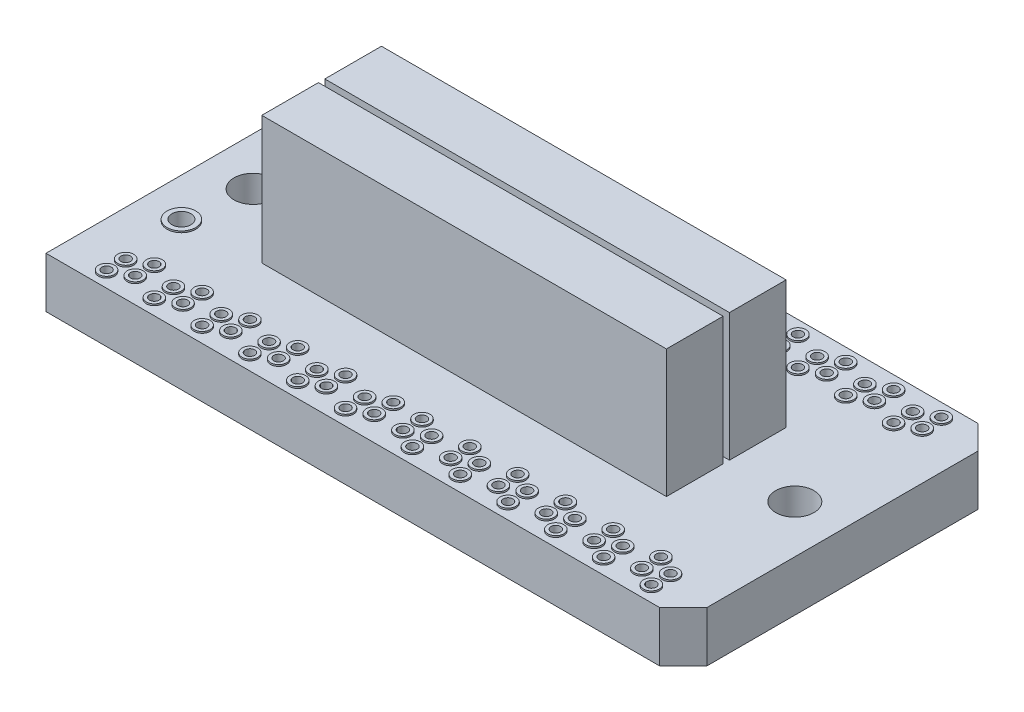
from build123d import *

# Parameters (mm, degrees)
SKETCH1_W                        = 20
SKETCH1_H                        = 10
PCB_DEPTH                        = 1.5875
SKETCH2_W                        = 12.7
SKETCH2_H                        = 1.778
CONNECTOR_DEPTH                  = 4.0132
SKETCH3_R                        = 0.15
CUT_EXTRUDE1_DEPTH               = 12.878795151
BOSS_EXTRUDE3_START              = 0.05
SKETCH4_R                        = 0.25
SKETCH4_R_2                      = 0.15
BOSS_EXTRUDE3_DEPTH              = 0.05
SKETCH5_R                        = 0.3
CUT_EXTRUDE2_DEPTH               = 12.878795151
BOSS_EXTRUDE4_START              = 0.05
SKETCH6_R                        = 0.45
SKETCH6_R_2                      = 0.3
BOSS_EXTRUDE4_DEPTH              = 0.05
LPATTERN1_COUNT                  = 6
LPATTERN1_PITCH                  = 1.5
MIRROR2_COPY_1_SKETCH_R          = 0.15
MIRROR2_COPY_1_DEPTH             = 12.878795151
MIRROR2_COPY_2_SKETCH_R          = 0.15
MIRROR2_COPY_2_DEPTH             = 12.878795151
MIRROR2_COPY_3_SKETCH_R          = 0.15
MIRROR2_COPY_3_DEPTH             = 12.878795151
MIRROR2_COPY_4_SKETCH_R          = 0.15
MIRROR2_COPY_4_DEPTH             = 12.878795151
MIRROR2_COPY_5_SKETCH_R          = 0.15
MIRROR2_COPY_5_DEPTH             = 12.878795151
MIRROR2_START                    = 0.05
MIRROR2_COPY_6_SKETCH_R          = 0.25
MIRROR2_COPY_6_SKETCH_R_2        = 0.15
MIRROR2_COPY_6_DEPTH             = 0.05
MIRROR2_COPY_7_SKETCH_R          = 0.25
MIRROR2_COPY_7_SKETCH_R_2        = 0.15
MIRROR2_COPY_7_DEPTH             = 0.05
MIRROR2_COPY_8_SKETCH_R          = 0.25
MIRROR2_COPY_8_SKETCH_R_2        = 0.15
MIRROR2_COPY_8_DEPTH             = 0.05
MIRROR2_COPY_9_SKETCH_R          = 0.25
MIRROR2_COPY_9_SKETCH_R_2        = 0.15
MIRROR2_COPY_9_DEPTH             = 0.05
MIRROR2_COPY_10_SKETCH_R         = 0.25
MIRROR2_COPY_10_SKETCH_R_2       = 0.15
MIRROR2_COPY_10_DEPTH            = 0.05
MIRROR2_COPY_11_SKETCH_R         = 0.15
MIRROR2_COPY_11_DEPTH            = 12.878795151
MIRROR2_COPY_12_SKETCH_R         = 0.25
MIRROR2_COPY_12_SKETCH_R_2       = 0.15
MIRROR2_COPY_12_DEPTH            = 0.05
MIRROR3_COPY_1_SKETCH_R          = 0.15
MIRROR3_COPY_1_DEPTH             = 12.878795151
MIRROR3_COPY_2_SKETCH_R          = 0.15
MIRROR3_COPY_2_DEPTH             = 12.878795151
MIRROR3_COPY_3_SKETCH_R          = 0.15
MIRROR3_COPY_3_DEPTH             = 12.878795151
MIRROR3_COPY_4_SKETCH_R          = 0.15
MIRROR3_COPY_4_DEPTH             = 12.878795151
MIRROR3_COPY_5_SKETCH_R          = 0.15
MIRROR3_COPY_5_DEPTH             = 12.878795151
MIRROR3_START                    = 0.05
MIRROR3_COPY_6_SKETCH_R          = 0.25
MIRROR3_COPY_6_SKETCH_R_2        = 0.15
MIRROR3_COPY_6_DEPTH             = 0.05
MIRROR3_COPY_7_SKETCH_R          = 0.25
MIRROR3_COPY_7_SKETCH_R_2        = 0.15
MIRROR3_COPY_7_DEPTH             = 0.05
MIRROR3_COPY_8_SKETCH_R          = 0.25
MIRROR3_COPY_8_SKETCH_R_2        = 0.15
MIRROR3_COPY_8_DEPTH             = 0.05
MIRROR3_COPY_9_SKETCH_R          = 0.25
MIRROR3_COPY_9_SKETCH_R_2        = 0.15
MIRROR3_COPY_9_DEPTH             = 0.05
MIRROR3_COPY_10_SKETCH_R         = 0.25
MIRROR3_COPY_10_SKETCH_R_2       = 0.15
MIRROR3_COPY_10_DEPTH            = 0.05
MIRROR3_COPY_11_SKETCH_R         = 0.15
MIRROR3_COPY_11_DEPTH            = 12.878795151
MIRROR3_COPY_12_SKETCH_R         = 0.25
MIRROR3_COPY_12_SKETCH_R_2       = 0.15
MIRROR3_COPY_12_DEPTH            = 0.05
MIRROR3_COPY_13_SKETCH_R         = 0.15
MIRROR3_COPY_13_DEPTH            = 12.878795151
MIRROR3_COPY_14_SKETCH_R         = 0.15
MIRROR3_COPY_14_DEPTH            = 12.878795151
MIRROR3_COPY_15_SKETCH_R         = 0.15
MIRROR3_COPY_15_DEPTH            = 12.878795151
MIRROR3_COPY_16_SKETCH_R         = 0.15
MIRROR3_COPY_16_DEPTH            = 12.878795151
MIRROR3_COPY_17_SKETCH_R         = 0.15
MIRROR3_COPY_17_DEPTH            = 12.878795151
MIRROR3_COPY_18_SKETCH_R         = 0.25
MIRROR3_COPY_18_SKETCH_R_2       = 0.15
MIRROR3_COPY_18_DEPTH            = 0.05
MIRROR3_COPY_19_SKETCH_R         = 0.25
MIRROR3_COPY_19_SKETCH_R_2       = 0.15
MIRROR3_COPY_19_DEPTH            = 0.05
MIRROR3_COPY_20_SKETCH_R         = 0.25
MIRROR3_COPY_20_SKETCH_R_2       = 0.15
MIRROR3_COPY_20_DEPTH            = 0.05
MIRROR3_COPY_21_SKETCH_R         = 0.25
MIRROR3_COPY_21_SKETCH_R_2       = 0.15
MIRROR3_COPY_21_DEPTH            = 0.05
MIRROR3_COPY_22_SKETCH_R         = 0.25
MIRROR3_COPY_22_SKETCH_R_2       = 0.15
MIRROR3_COPY_22_DEPTH            = 0.05
MIRROR3_COPY_23_SKETCH_R         = 0.15
MIRROR3_COPY_23_DEPTH            = 12.878795151
MIRROR3_COPY_24_SKETCH_R         = 0.25
MIRROR3_COPY_24_SKETCH_R_2       = 0.15
MIRROR3_COPY_24_DEPTH            = 0.05
MIRROR3_COPY_25_SKETCH_R         = 0.15
MIRROR3_COPY_25_DEPTH            = 12.878795151
MIRROR3_COPY_26_SKETCH_R         = 0.25
MIRROR3_COPY_26_SKETCH_R_2       = 0.15
MIRROR3_COPY_26_DEPTH            = 0.05
CHAMFER1_SIZE                    = 0.75
SKETCH8_W                        = 0.288461539
SKETCH8_H                        = 1.5
BOSS_EXTRUDE_LABEL_DEPTH         = 0.01
SKETCH9_R                        = 0.6
CUT_EXTRUDE_MOUNTING_HOLES_DEPTH = 10


with BuildPart() as part:
    # Sketch1 → PCB (new body)
    with BuildSketch(Plane(origin=(0, 0, 0), x_dir=(1, 0, 0), z_dir=(0, 1, 0))):
        Rectangle(SKETCH1_W, SKETCH1_H)
    extrude(amount=PCB_DEPTH)

    # Sketch2 → Connector (add)
    with BuildSketch(Plane(origin=(0, 1.5875, 0), x_dir=(1, 0, 0), z_dir=(0, 1, 0))):
        with Locations((0, -0.989)):
            Rectangle(SKETCH2_W, SKETCH2_H)
    connector = extrude(amount=CONNECTOR_DEPTH)

    # Mirror1: Connector across plane
    add(connector.mirror(Plane.XY))

    # Sketch3 → Cut-Extrude1 (cut, through all)
    with BuildSketch(Plane(origin=(0, 1.5875, 0), x_dir=(1, 0, 0), z_dir=(0, 1, 0))):
        with Locations((-0.45, -3.65)):
            Circle(SKETCH3_R)
        with Locations((-0.45, -4.25)):
            Circle(SKETCH3_R)
        with Locations((-1.05, -3.95)):
            Circle(SKETCH3_R)
        with Locations((-1.05, -4.55)):
            Circle(SKETCH3_R)
    cut_extrude1 = extrude(amount=-CUT_EXTRUDE1_DEPTH, mode=Mode.SUBTRACT)

    # Sketch4 → Boss-Extrude3 (add)
    # profile 1 of 4: a face of its own
    with BuildSketch(Plane(origin=(0, 1.5875, 0), x_dir=(1, 0, 0), z_dir=(0, 1, 0)).offset(BOSS_EXTRUDE3_START)):
        with Locations((-1.05, -4.55)):
            Circle(SKETCH4_R)
        with Locations((-1.05, -4.55)):
            Circle(SKETCH4_R_2, mode=Mode.SUBTRACT)
    # profile 2 of 4: a face of its own
    with BuildSketch(Plane(origin=(0, 1.5875, 0), x_dir=(1, 0, 0), z_dir=(0, 1, 0)).offset(BOSS_EXTRUDE3_START)):
        with Locations((-0.45, -4.25)):
            Circle(SKETCH4_R)
        with Locations((-0.45, -4.25)):
            Circle(SKETCH4_R_2, mode=Mode.SUBTRACT)
    # profile 3 of 4: a face of its own
    with BuildSketch(Plane(origin=(0, 1.5875, 0), x_dir=(1, 0, 0), z_dir=(0, 1, 0)).offset(BOSS_EXTRUDE3_START)):
        with Locations((-0.45, -3.65)):
            Circle(SKETCH4_R)
        with Locations((-0.45, -3.65)):
            Circle(SKETCH4_R_2, mode=Mode.SUBTRACT)
    # profile 4 of 4: a face of its own
    with BuildSketch(Plane(origin=(0, 1.5875, 0), x_dir=(1, 0, 0), z_dir=(0, 1, 0)).offset(BOSS_EXTRUDE3_START)):
        with Locations((-1.05, -3.95)):
            Circle(SKETCH4_R)
        with Locations((-1.05, -3.95)):
            Circle(SKETCH4_R_2, mode=Mode.SUBTRACT)
    boss_extrude3 = extrude(amount=-BOSS_EXTRUDE3_DEPTH)

    # Sketch5 → Cut-Extrude2 (cut, through all)
    with BuildSketch(Plane(origin=(0, 1.5875, 0), x_dir=(1, 0, 0), z_dir=(0, 1, 0))):
        with Locations((-8.75, -2)):
            Circle(SKETCH5_R)
    cut_extrude2 = extrude(amount=-CUT_EXTRUDE2_DEPTH, mode=Mode.SUBTRACT)

    # Sketch6 → Boss-Extrude4 (add)
    with BuildSketch(Plane(origin=(0, 1.5875, 0), x_dir=(1, 0, 0), z_dir=(0, 1, 0)).offset(BOSS_EXTRUDE4_START)):
        with Locations((-8.75, -2)):
            Circle(SKETCH6_R)
        with Locations((-8.75, -2)):
            Circle(SKETCH6_R_2, mode=Mode.SUBTRACT)
    boss_extrude4 = extrude(amount=-BOSS_EXTRUDE4_DEPTH)

    # LPattern1: Cut-Extrude1, Boss-Extrude3 ×6
    with Locations(*[(-i * LPATTERN1_PITCH, 0, 0) for i in range(1, LPATTERN1_COUNT)]):
        add(cut_extrude1, mode=Mode.SUBTRACT)
        add(boss_extrude3)

    # Mirror2 copy 1 sketch → Mirror2 copy 1 (cut, through all)
    with BuildSketch(Plane(origin=(1.5, 1.5875, 0), x_dir=(-1, 0, 0), z_dir=(0, 1, 0))):
        with Locations((-0.45, 3.65)):
            Circle(MIRROR2_COPY_1_SKETCH_R)
        with Locations((-0.45, 4.25)):
            Circle(MIRROR2_COPY_1_SKETCH_R)
        with Locations((-1.05, 3.95)):
            Circle(MIRROR2_COPY_1_SKETCH_R)
        with Locations((-1.05, 4.55)):
            Circle(MIRROR2_COPY_1_SKETCH_R)
    extrude(amount=-MIRROR2_COPY_1_DEPTH, mode=Mode.SUBTRACT)

    # Mirror2 copy 2 sketch → Mirror2 copy 2 (cut, through all)
    with BuildSketch(Plane(origin=(3, 1.5875, 0), x_dir=(-1, 0, 0), z_dir=(0, 1, 0))):
        with Locations((-0.45, 3.65)):
            Circle(MIRROR2_COPY_2_SKETCH_R)
        with Locations((-0.45, 4.25)):
            Circle(MIRROR2_COPY_2_SKETCH_R)
        with Locations((-1.05, 3.95)):
            Circle(MIRROR2_COPY_2_SKETCH_R)
        with Locations((-1.05, 4.55)):
            Circle(MIRROR2_COPY_2_SKETCH_R)
    extrude(amount=-MIRROR2_COPY_2_DEPTH, mode=Mode.SUBTRACT)

    # Mirror2 copy 3 sketch → Mirror2 copy 3 (cut, through all)
    with BuildSketch(Plane(origin=(4.5, 1.5875, 0), x_dir=(-1, 0, 0), z_dir=(0, 1, 0))):
        with Locations((-0.45, 3.65)):
            Circle(MIRROR2_COPY_3_SKETCH_R)
        with Locations((-0.45, 4.25)):
            Circle(MIRROR2_COPY_3_SKETCH_R)
        with Locations((-1.05, 3.95)):
            Circle(MIRROR2_COPY_3_SKETCH_R)
        with Locations((-1.05, 4.55)):
            Circle(MIRROR2_COPY_3_SKETCH_R)
    extrude(amount=-MIRROR2_COPY_3_DEPTH, mode=Mode.SUBTRACT)

    # Mirror2 copy 4 sketch → Mirror2 copy 4 (cut, through all)
    with BuildSketch(Plane(origin=(6, 1.5875, 0), x_dir=(-1, 0, 0), z_dir=(0, 1, 0))):
        with Locations((-0.45, 3.65)):
            Circle(MIRROR2_COPY_4_SKETCH_R)
        with Locations((-0.45, 4.25)):
            Circle(MIRROR2_COPY_4_SKETCH_R)
        with Locations((-1.05, 3.95)):
            Circle(MIRROR2_COPY_4_SKETCH_R)
        with Locations((-1.05, 4.55)):
            Circle(MIRROR2_COPY_4_SKETCH_R)
    extrude(amount=-MIRROR2_COPY_4_DEPTH, mode=Mode.SUBTRACT)

    # Mirror2 copy 5 sketch → Mirror2 copy 5 (cut, through all)
    with BuildSketch(Plane(origin=(7.5, 1.5875, 0), x_dir=(-1, 0, 0), z_dir=(0, 1, 0))):
        with Locations((-0.45, 3.65)):
            Circle(MIRROR2_COPY_5_SKETCH_R)
        with Locations((-0.45, 4.25)):
            Circle(MIRROR2_COPY_5_SKETCH_R)
        with Locations((-1.05, 3.95)):
            Circle(MIRROR2_COPY_5_SKETCH_R)
        with Locations((-1.05, 4.55)):
            Circle(MIRROR2_COPY_5_SKETCH_R)
    extrude(amount=-MIRROR2_COPY_5_DEPTH, mode=Mode.SUBTRACT)

    # Mirror2 copy 6 sketch → Mirror2 copy 6 (add)
    # profile 1 of 4: a face of its own
    with BuildSketch(Plane(origin=(1.5, 1.5875, 0), x_dir=(-1, 0, 0), z_dir=(0, 1, 0)).offset(MIRROR2_START)):
        with Locations((-1.05, 4.55)):
            Circle(MIRROR2_COPY_6_SKETCH_R)
        with Locations((-1.05, 4.55)):
            Circle(MIRROR2_COPY_6_SKETCH_R_2, mode=Mode.SUBTRACT)
    # profile 2 of 4: a face of its own
    with BuildSketch(Plane(origin=(1.5, 1.5875, 0), x_dir=(-1, 0, 0), z_dir=(0, 1, 0)).offset(MIRROR2_START)):
        with Locations((-0.45, 4.25)):
            Circle(MIRROR2_COPY_6_SKETCH_R)
        with Locations((-0.45, 4.25)):
            Circle(MIRROR2_COPY_6_SKETCH_R_2, mode=Mode.SUBTRACT)
    # profile 3 of 4: a face of its own
    with BuildSketch(Plane(origin=(1.5, 1.5875, 0), x_dir=(-1, 0, 0), z_dir=(0, 1, 0)).offset(MIRROR2_START)):
        with Locations((-0.45, 3.65)):
            Circle(MIRROR2_COPY_6_SKETCH_R)
        with Locations((-0.45, 3.65)):
            Circle(MIRROR2_COPY_6_SKETCH_R_2, mode=Mode.SUBTRACT)
    # profile 4 of 4: a face of its own
    with BuildSketch(Plane(origin=(1.5, 1.5875, 0), x_dir=(-1, 0, 0), z_dir=(0, 1, 0)).offset(MIRROR2_START)):
        with Locations((-1.05, 3.95)):
            Circle(MIRROR2_COPY_6_SKETCH_R)
        with Locations((-1.05, 3.95)):
            Circle(MIRROR2_COPY_6_SKETCH_R_2, mode=Mode.SUBTRACT)
    extrude(amount=-MIRROR2_COPY_6_DEPTH)

    # Mirror2 copy 7 sketch → Mirror2 copy 7 (add)
    # profile 1 of 4: a face of its own
    with BuildSketch(Plane(origin=(3, 1.5875, 0), x_dir=(-1, 0, 0), z_dir=(0, 1, 0)).offset(MIRROR2_START)):
        with Locations((-1.05, 4.55)):
            Circle(MIRROR2_COPY_7_SKETCH_R)
        with Locations((-1.05, 4.55)):
            Circle(MIRROR2_COPY_7_SKETCH_R_2, mode=Mode.SUBTRACT)
    # profile 2 of 4: a face of its own
    with BuildSketch(Plane(origin=(3, 1.5875, 0), x_dir=(-1, 0, 0), z_dir=(0, 1, 0)).offset(MIRROR2_START)):
        with Locations((-0.45, 4.25)):
            Circle(MIRROR2_COPY_7_SKETCH_R)
        with Locations((-0.45, 4.25)):
            Circle(MIRROR2_COPY_7_SKETCH_R_2, mode=Mode.SUBTRACT)
    # profile 3 of 4: a face of its own
    with BuildSketch(Plane(origin=(3, 1.5875, 0), x_dir=(-1, 0, 0), z_dir=(0, 1, 0)).offset(MIRROR2_START)):
        with Locations((-0.45, 3.65)):
            Circle(MIRROR2_COPY_7_SKETCH_R)
        with Locations((-0.45, 3.65)):
            Circle(MIRROR2_COPY_7_SKETCH_R_2, mode=Mode.SUBTRACT)
    # profile 4 of 4: a face of its own
    with BuildSketch(Plane(origin=(3, 1.5875, 0), x_dir=(-1, 0, 0), z_dir=(0, 1, 0)).offset(MIRROR2_START)):
        with Locations((-1.05, 3.95)):
            Circle(MIRROR2_COPY_7_SKETCH_R)
        with Locations((-1.05, 3.95)):
            Circle(MIRROR2_COPY_7_SKETCH_R_2, mode=Mode.SUBTRACT)
    extrude(amount=-MIRROR2_COPY_7_DEPTH)

    # Mirror2 copy 8 sketch → Mirror2 copy 8 (add)
    # profile 1 of 4: a face of its own
    with BuildSketch(Plane(origin=(4.5, 1.5875, 0), x_dir=(-1, 0, 0), z_dir=(0, 1, 0)).offset(MIRROR2_START)):
        with Locations((-1.05, 4.55)):
            Circle(MIRROR2_COPY_8_SKETCH_R)
        with Locations((-1.05, 4.55)):
            Circle(MIRROR2_COPY_8_SKETCH_R_2, mode=Mode.SUBTRACT)
    # profile 2 of 4: a face of its own
    with BuildSketch(Plane(origin=(4.5, 1.5875, 0), x_dir=(-1, 0, 0), z_dir=(0, 1, 0)).offset(MIRROR2_START)):
        with Locations((-0.45, 4.25)):
            Circle(MIRROR2_COPY_8_SKETCH_R)
        with Locations((-0.45, 4.25)):
            Circle(MIRROR2_COPY_8_SKETCH_R_2, mode=Mode.SUBTRACT)
    # profile 3 of 4: a face of its own
    with BuildSketch(Plane(origin=(4.5, 1.5875, 0), x_dir=(-1, 0, 0), z_dir=(0, 1, 0)).offset(MIRROR2_START)):
        with Locations((-0.45, 3.65)):
            Circle(MIRROR2_COPY_8_SKETCH_R)
        with Locations((-0.45, 3.65)):
            Circle(MIRROR2_COPY_8_SKETCH_R_2, mode=Mode.SUBTRACT)
    # profile 4 of 4: a face of its own
    with BuildSketch(Plane(origin=(4.5, 1.5875, 0), x_dir=(-1, 0, 0), z_dir=(0, 1, 0)).offset(MIRROR2_START)):
        with Locations((-1.05, 3.95)):
            Circle(MIRROR2_COPY_8_SKETCH_R)
        with Locations((-1.05, 3.95)):
            Circle(MIRROR2_COPY_8_SKETCH_R_2, mode=Mode.SUBTRACT)
    extrude(amount=-MIRROR2_COPY_8_DEPTH)

    # Mirror2 copy 9 sketch → Mirror2 copy 9 (add)
    # profile 1 of 4: a face of its own
    with BuildSketch(Plane(origin=(6, 1.5875, 0), x_dir=(-1, 0, 0), z_dir=(0, 1, 0)).offset(MIRROR2_START)):
        with Locations((-1.05, 4.55)):
            Circle(MIRROR2_COPY_9_SKETCH_R)
        with Locations((-1.05, 4.55)):
            Circle(MIRROR2_COPY_9_SKETCH_R_2, mode=Mode.SUBTRACT)
    # profile 2 of 4: a face of its own
    with BuildSketch(Plane(origin=(6, 1.5875, 0), x_dir=(-1, 0, 0), z_dir=(0, 1, 0)).offset(MIRROR2_START)):
        with Locations((-0.45, 4.25)):
            Circle(MIRROR2_COPY_9_SKETCH_R)
        with Locations((-0.45, 4.25)):
            Circle(MIRROR2_COPY_9_SKETCH_R_2, mode=Mode.SUBTRACT)
    # profile 3 of 4: a face of its own
    with BuildSketch(Plane(origin=(6, 1.5875, 0), x_dir=(-1, 0, 0), z_dir=(0, 1, 0)).offset(MIRROR2_START)):
        with Locations((-0.45, 3.65)):
            Circle(MIRROR2_COPY_9_SKETCH_R)
        with Locations((-0.45, 3.65)):
            Circle(MIRROR2_COPY_9_SKETCH_R_2, mode=Mode.SUBTRACT)
    # profile 4 of 4: a face of its own
    with BuildSketch(Plane(origin=(6, 1.5875, 0), x_dir=(-1, 0, 0), z_dir=(0, 1, 0)).offset(MIRROR2_START)):
        with Locations((-1.05, 3.95)):
            Circle(MIRROR2_COPY_9_SKETCH_R)
        with Locations((-1.05, 3.95)):
            Circle(MIRROR2_COPY_9_SKETCH_R_2, mode=Mode.SUBTRACT)
    extrude(amount=-MIRROR2_COPY_9_DEPTH)

    # Mirror2 copy 10 sketch → Mirror2 copy 10 (add)
    # profile 1 of 4: a face of its own
    with BuildSketch(Plane(origin=(7.5, 1.5875, 0), x_dir=(-1, 0, 0), z_dir=(0, 1, 0)).offset(MIRROR2_START)):
        with Locations((-1.05, 4.55)):
            Circle(MIRROR2_COPY_10_SKETCH_R)
        with Locations((-1.05, 4.55)):
            Circle(MIRROR2_COPY_10_SKETCH_R_2, mode=Mode.SUBTRACT)
    # profile 2 of 4: a face of its own
    with BuildSketch(Plane(origin=(7.5, 1.5875, 0), x_dir=(-1, 0, 0), z_dir=(0, 1, 0)).offset(MIRROR2_START)):
        with Locations((-0.45, 4.25)):
            Circle(MIRROR2_COPY_10_SKETCH_R)
        with Locations((-0.45, 4.25)):
            Circle(MIRROR2_COPY_10_SKETCH_R_2, mode=Mode.SUBTRACT)
    # profile 3 of 4: a face of its own
    with BuildSketch(Plane(origin=(7.5, 1.5875, 0), x_dir=(-1, 0, 0), z_dir=(0, 1, 0)).offset(MIRROR2_START)):
        with Locations((-0.45, 3.65)):
            Circle(MIRROR2_COPY_10_SKETCH_R)
        with Locations((-0.45, 3.65)):
            Circle(MIRROR2_COPY_10_SKETCH_R_2, mode=Mode.SUBTRACT)
    # profile 4 of 4: a face of its own
    with BuildSketch(Plane(origin=(7.5, 1.5875, 0), x_dir=(-1, 0, 0), z_dir=(0, 1, 0)).offset(MIRROR2_START)):
        with Locations((-1.05, 3.95)):
            Circle(MIRROR2_COPY_10_SKETCH_R)
        with Locations((-1.05, 3.95)):
            Circle(MIRROR2_COPY_10_SKETCH_R_2, mode=Mode.SUBTRACT)
    extrude(amount=-MIRROR2_COPY_10_DEPTH)

    # Mirror2 copy 11 sketch → Mirror2 copy 11 (cut, through all)
    with BuildSketch(Plane(origin=(0, 1.5875, 0), x_dir=(-1, 0, 0), z_dir=(0, 1, 0))):
        with Locations((-0.45, 3.65)):
            Circle(MIRROR2_COPY_11_SKETCH_R)
        with Locations((-0.45, 4.25)):
            Circle(MIRROR2_COPY_11_SKETCH_R)
        with Locations((-1.05, 3.95)):
            Circle(MIRROR2_COPY_11_SKETCH_R)
        with Locations((-1.05, 4.55)):
            Circle(MIRROR2_COPY_11_SKETCH_R)
    extrude(amount=-MIRROR2_COPY_11_DEPTH, mode=Mode.SUBTRACT)

    # Mirror2 copy 12 sketch → Mirror2 copy 12 (add)
    # profile 1 of 4: a face of its own
    with BuildSketch(Plane(origin=(0, 1.5875, 0), x_dir=(-1, 0, 0), z_dir=(0, 1, 0)).offset(MIRROR2_START)):
        with Locations((-1.05, 4.55)):
            Circle(MIRROR2_COPY_12_SKETCH_R)
        with Locations((-1.05, 4.55)):
            Circle(MIRROR2_COPY_12_SKETCH_R_2, mode=Mode.SUBTRACT)
    # profile 2 of 4: a face of its own
    with BuildSketch(Plane(origin=(0, 1.5875, 0), x_dir=(-1, 0, 0), z_dir=(0, 1, 0)).offset(MIRROR2_START)):
        with Locations((-0.45, 4.25)):
            Circle(MIRROR2_COPY_12_SKETCH_R)
        with Locations((-0.45, 4.25)):
            Circle(MIRROR2_COPY_12_SKETCH_R_2, mode=Mode.SUBTRACT)
    # profile 3 of 4: a face of its own
    with BuildSketch(Plane(origin=(0, 1.5875, 0), x_dir=(-1, 0, 0), z_dir=(0, 1, 0)).offset(MIRROR2_START)):
        with Locations((-0.45, 3.65)):
            Circle(MIRROR2_COPY_12_SKETCH_R)
        with Locations((-0.45, 3.65)):
            Circle(MIRROR2_COPY_12_SKETCH_R_2, mode=Mode.SUBTRACT)
    # profile 4 of 4: a face of its own
    with BuildSketch(Plane(origin=(0, 1.5875, 0), x_dir=(-1, 0, 0), z_dir=(0, 1, 0)).offset(MIRROR2_START)):
        with Locations((-1.05, 3.95)):
            Circle(MIRROR2_COPY_12_SKETCH_R)
        with Locations((-1.05, 3.95)):
            Circle(MIRROR2_COPY_12_SKETCH_R_2, mode=Mode.SUBTRACT)
    extrude(amount=-MIRROR2_COPY_12_DEPTH)

    # Mirror3: Cut-Extrude2, Boss-Extrude4 across plane
    add(cut_extrude2.mirror(Plane.XY), mode=Mode.SUBTRACT)
    add(boss_extrude4.mirror(Plane.XY))

    # Mirror3 copy 1 sketch → Mirror3 copy 1 (cut, through all)
    with BuildSketch(Plane(origin=(-1.5, 1.5875, 0), x_dir=(1, 0, 0), z_dir=(0, 1, 0))):
        with Locations((-0.45, 3.65)):
            Circle(MIRROR3_COPY_1_SKETCH_R)
        with Locations((-0.45, 4.25)):
            Circle(MIRROR3_COPY_1_SKETCH_R)
        with Locations((-1.05, 3.95)):
            Circle(MIRROR3_COPY_1_SKETCH_R)
        with Locations((-1.05, 4.55)):
            Circle(MIRROR3_COPY_1_SKETCH_R)
    extrude(amount=-MIRROR3_COPY_1_DEPTH, mode=Mode.SUBTRACT)

    # Mirror3 copy 2 sketch → Mirror3 copy 2 (cut, through all)
    with BuildSketch(Plane(origin=(-3, 1.5875, 0), x_dir=(1, 0, 0), z_dir=(0, 1, 0))):
        with Locations((-0.45, 3.65)):
            Circle(MIRROR3_COPY_2_SKETCH_R)
        with Locations((-0.45, 4.25)):
            Circle(MIRROR3_COPY_2_SKETCH_R)
        with Locations((-1.05, 3.95)):
            Circle(MIRROR3_COPY_2_SKETCH_R)
        with Locations((-1.05, 4.55)):
            Circle(MIRROR3_COPY_2_SKETCH_R)
    extrude(amount=-MIRROR3_COPY_2_DEPTH, mode=Mode.SUBTRACT)

    # Mirror3 copy 3 sketch → Mirror3 copy 3 (cut, through all)
    with BuildSketch(Plane(origin=(-4.5, 1.5875, 0), x_dir=(1, 0, 0), z_dir=(0, 1, 0))):
        with Locations((-0.45, 3.65)):
            Circle(MIRROR3_COPY_3_SKETCH_R)
        with Locations((-0.45, 4.25)):
            Circle(MIRROR3_COPY_3_SKETCH_R)
        with Locations((-1.05, 3.95)):
            Circle(MIRROR3_COPY_3_SKETCH_R)
        with Locations((-1.05, 4.55)):
            Circle(MIRROR3_COPY_3_SKETCH_R)
    extrude(amount=-MIRROR3_COPY_3_DEPTH, mode=Mode.SUBTRACT)

    # Mirror3 copy 4 sketch → Mirror3 copy 4 (cut, through all)
    with BuildSketch(Plane(origin=(-6, 1.5875, 0), x_dir=(1, 0, 0), z_dir=(0, 1, 0))):
        with Locations((-0.45, 3.65)):
            Circle(MIRROR3_COPY_4_SKETCH_R)
        with Locations((-0.45, 4.25)):
            Circle(MIRROR3_COPY_4_SKETCH_R)
        with Locations((-1.05, 3.95)):
            Circle(MIRROR3_COPY_4_SKETCH_R)
        with Locations((-1.05, 4.55)):
            Circle(MIRROR3_COPY_4_SKETCH_R)
    extrude(amount=-MIRROR3_COPY_4_DEPTH, mode=Mode.SUBTRACT)

    # Mirror3 copy 5 sketch → Mirror3 copy 5 (cut, through all)
    with BuildSketch(Plane(origin=(-7.5, 1.5875, 0), x_dir=(1, 0, 0), z_dir=(0, 1, 0))):
        with Locations((-0.45, 3.65)):
            Circle(MIRROR3_COPY_5_SKETCH_R)
        with Locations((-0.45, 4.25)):
            Circle(MIRROR3_COPY_5_SKETCH_R)
        with Locations((-1.05, 3.95)):
            Circle(MIRROR3_COPY_5_SKETCH_R)
        with Locations((-1.05, 4.55)):
            Circle(MIRROR3_COPY_5_SKETCH_R)
    extrude(amount=-MIRROR3_COPY_5_DEPTH, mode=Mode.SUBTRACT)

    # Mirror3 copy 6 sketch → Mirror3 copy 6 (add)
    # profile 1 of 4: a face of its own
    with BuildSketch(Plane(origin=(-1.5, 1.5875, 0), x_dir=(1, 0, 0), z_dir=(0, 1, 0)).offset(MIRROR3_START)):
        with Locations((-1.05, 4.55)):
            Circle(MIRROR3_COPY_6_SKETCH_R)
        with Locations((-1.05, 4.55)):
            Circle(MIRROR3_COPY_6_SKETCH_R_2, mode=Mode.SUBTRACT)
    # profile 2 of 4: a face of its own
    with BuildSketch(Plane(origin=(-1.5, 1.5875, 0), x_dir=(1, 0, 0), z_dir=(0, 1, 0)).offset(MIRROR3_START)):
        with Locations((-0.45, 4.25)):
            Circle(MIRROR3_COPY_6_SKETCH_R)
        with Locations((-0.45, 4.25)):
            Circle(MIRROR3_COPY_6_SKETCH_R_2, mode=Mode.SUBTRACT)
    # profile 3 of 4: a face of its own
    with BuildSketch(Plane(origin=(-1.5, 1.5875, 0), x_dir=(1, 0, 0), z_dir=(0, 1, 0)).offset(MIRROR3_START)):
        with Locations((-0.45, 3.65)):
            Circle(MIRROR3_COPY_6_SKETCH_R)
        with Locations((-0.45, 3.65)):
            Circle(MIRROR3_COPY_6_SKETCH_R_2, mode=Mode.SUBTRACT)
    # profile 4 of 4: a face of its own
    with BuildSketch(Plane(origin=(-1.5, 1.5875, 0), x_dir=(1, 0, 0), z_dir=(0, 1, 0)).offset(MIRROR3_START)):
        with Locations((-1.05, 3.95)):
            Circle(MIRROR3_COPY_6_SKETCH_R)
        with Locations((-1.05, 3.95)):
            Circle(MIRROR3_COPY_6_SKETCH_R_2, mode=Mode.SUBTRACT)
    extrude(amount=-MIRROR3_COPY_6_DEPTH)

    # Mirror3 copy 7 sketch → Mirror3 copy 7 (add)
    # profile 1 of 4: a face of its own
    with BuildSketch(Plane(origin=(-3, 1.5875, 0), x_dir=(1, 0, 0), z_dir=(0, 1, 0)).offset(MIRROR3_START)):
        with Locations((-1.05, 4.55)):
            Circle(MIRROR3_COPY_7_SKETCH_R)
        with Locations((-1.05, 4.55)):
            Circle(MIRROR3_COPY_7_SKETCH_R_2, mode=Mode.SUBTRACT)
    # profile 2 of 4: a face of its own
    with BuildSketch(Plane(origin=(-3, 1.5875, 0), x_dir=(1, 0, 0), z_dir=(0, 1, 0)).offset(MIRROR3_START)):
        with Locations((-0.45, 4.25)):
            Circle(MIRROR3_COPY_7_SKETCH_R)
        with Locations((-0.45, 4.25)):
            Circle(MIRROR3_COPY_7_SKETCH_R_2, mode=Mode.SUBTRACT)
    # profile 3 of 4: a face of its own
    with BuildSketch(Plane(origin=(-3, 1.5875, 0), x_dir=(1, 0, 0), z_dir=(0, 1, 0)).offset(MIRROR3_START)):
        with Locations((-0.45, 3.65)):
            Circle(MIRROR3_COPY_7_SKETCH_R)
        with Locations((-0.45, 3.65)):
            Circle(MIRROR3_COPY_7_SKETCH_R_2, mode=Mode.SUBTRACT)
    # profile 4 of 4: a face of its own
    with BuildSketch(Plane(origin=(-3, 1.5875, 0), x_dir=(1, 0, 0), z_dir=(0, 1, 0)).offset(MIRROR3_START)):
        with Locations((-1.05, 3.95)):
            Circle(MIRROR3_COPY_7_SKETCH_R)
        with Locations((-1.05, 3.95)):
            Circle(MIRROR3_COPY_7_SKETCH_R_2, mode=Mode.SUBTRACT)
    extrude(amount=-MIRROR3_COPY_7_DEPTH)

    # Mirror3 copy 8 sketch → Mirror3 copy 8 (add)
    # profile 1 of 4: a face of its own
    with BuildSketch(Plane(origin=(-4.5, 1.5875, 0), x_dir=(1, 0, 0), z_dir=(0, 1, 0)).offset(MIRROR3_START)):
        with Locations((-1.05, 4.55)):
            Circle(MIRROR3_COPY_8_SKETCH_R)
        with Locations((-1.05, 4.55)):
            Circle(MIRROR3_COPY_8_SKETCH_R_2, mode=Mode.SUBTRACT)
    # profile 2 of 4: a face of its own
    with BuildSketch(Plane(origin=(-4.5, 1.5875, 0), x_dir=(1, 0, 0), z_dir=(0, 1, 0)).offset(MIRROR3_START)):
        with Locations((-0.45, 4.25)):
            Circle(MIRROR3_COPY_8_SKETCH_R)
        with Locations((-0.45, 4.25)):
            Circle(MIRROR3_COPY_8_SKETCH_R_2, mode=Mode.SUBTRACT)
    # profile 3 of 4: a face of its own
    with BuildSketch(Plane(origin=(-4.5, 1.5875, 0), x_dir=(1, 0, 0), z_dir=(0, 1, 0)).offset(MIRROR3_START)):
        with Locations((-0.45, 3.65)):
            Circle(MIRROR3_COPY_8_SKETCH_R)
        with Locations((-0.45, 3.65)):
            Circle(MIRROR3_COPY_8_SKETCH_R_2, mode=Mode.SUBTRACT)
    # profile 4 of 4: a face of its own
    with BuildSketch(Plane(origin=(-4.5, 1.5875, 0), x_dir=(1, 0, 0), z_dir=(0, 1, 0)).offset(MIRROR3_START)):
        with Locations((-1.05, 3.95)):
            Circle(MIRROR3_COPY_8_SKETCH_R)
        with Locations((-1.05, 3.95)):
            Circle(MIRROR3_COPY_8_SKETCH_R_2, mode=Mode.SUBTRACT)
    extrude(amount=-MIRROR3_COPY_8_DEPTH)

    # Mirror3 copy 9 sketch → Mirror3 copy 9 (add)
    # profile 1 of 4: a face of its own
    with BuildSketch(Plane(origin=(-6, 1.5875, 0), x_dir=(1, 0, 0), z_dir=(0, 1, 0)).offset(MIRROR3_START)):
        with Locations((-1.05, 4.55)):
            Circle(MIRROR3_COPY_9_SKETCH_R)
        with Locations((-1.05, 4.55)):
            Circle(MIRROR3_COPY_9_SKETCH_R_2, mode=Mode.SUBTRACT)
    # profile 2 of 4: a face of its own
    with BuildSketch(Plane(origin=(-6, 1.5875, 0), x_dir=(1, 0, 0), z_dir=(0, 1, 0)).offset(MIRROR3_START)):
        with Locations((-0.45, 4.25)):
            Circle(MIRROR3_COPY_9_SKETCH_R)
        with Locations((-0.45, 4.25)):
            Circle(MIRROR3_COPY_9_SKETCH_R_2, mode=Mode.SUBTRACT)
    # profile 3 of 4: a face of its own
    with BuildSketch(Plane(origin=(-6, 1.5875, 0), x_dir=(1, 0, 0), z_dir=(0, 1, 0)).offset(MIRROR3_START)):
        with Locations((-0.45, 3.65)):
            Circle(MIRROR3_COPY_9_SKETCH_R)
        with Locations((-0.45, 3.65)):
            Circle(MIRROR3_COPY_9_SKETCH_R_2, mode=Mode.SUBTRACT)
    # profile 4 of 4: a face of its own
    with BuildSketch(Plane(origin=(-6, 1.5875, 0), x_dir=(1, 0, 0), z_dir=(0, 1, 0)).offset(MIRROR3_START)):
        with Locations((-1.05, 3.95)):
            Circle(MIRROR3_COPY_9_SKETCH_R)
        with Locations((-1.05, 3.95)):
            Circle(MIRROR3_COPY_9_SKETCH_R_2, mode=Mode.SUBTRACT)
    extrude(amount=-MIRROR3_COPY_9_DEPTH)

    # Mirror3 copy 10 sketch → Mirror3 copy 10 (add)
    # profile 1 of 4: a face of its own
    with BuildSketch(Plane(origin=(-7.5, 1.5875, 0), x_dir=(1, 0, 0), z_dir=(0, 1, 0)).offset(MIRROR3_START)):
        with Locations((-1.05, 4.55)):
            Circle(MIRROR3_COPY_10_SKETCH_R)
        with Locations((-1.05, 4.55)):
            Circle(MIRROR3_COPY_10_SKETCH_R_2, mode=Mode.SUBTRACT)
    # profile 2 of 4: a face of its own
    with BuildSketch(Plane(origin=(-7.5, 1.5875, 0), x_dir=(1, 0, 0), z_dir=(0, 1, 0)).offset(MIRROR3_START)):
        with Locations((-0.45, 4.25)):
            Circle(MIRROR3_COPY_10_SKETCH_R)
        with Locations((-0.45, 4.25)):
            Circle(MIRROR3_COPY_10_SKETCH_R_2, mode=Mode.SUBTRACT)
    # profile 3 of 4: a face of its own
    with BuildSketch(Plane(origin=(-7.5, 1.5875, 0), x_dir=(1, 0, 0), z_dir=(0, 1, 0)).offset(MIRROR3_START)):
        with Locations((-0.45, 3.65)):
            Circle(MIRROR3_COPY_10_SKETCH_R)
        with Locations((-0.45, 3.65)):
            Circle(MIRROR3_COPY_10_SKETCH_R_2, mode=Mode.SUBTRACT)
    # profile 4 of 4: a face of its own
    with BuildSketch(Plane(origin=(-7.5, 1.5875, 0), x_dir=(1, 0, 0), z_dir=(0, 1, 0)).offset(MIRROR3_START)):
        with Locations((-1.05, 3.95)):
            Circle(MIRROR3_COPY_10_SKETCH_R)
        with Locations((-1.05, 3.95)):
            Circle(MIRROR3_COPY_10_SKETCH_R_2, mode=Mode.SUBTRACT)
    extrude(amount=-MIRROR3_COPY_10_DEPTH)

    # Mirror3 copy 11 sketch → Mirror3 copy 11 (cut, through all)
    with BuildSketch(Plane(origin=(0, 1.5875, 0), x_dir=(1, 0, 0), z_dir=(0, 1, 0))):
        with Locations((-0.45, 3.65)):
            Circle(MIRROR3_COPY_11_SKETCH_R)
        with Locations((-0.45, 4.25)):
            Circle(MIRROR3_COPY_11_SKETCH_R)
        with Locations((-1.05, 3.95)):
            Circle(MIRROR3_COPY_11_SKETCH_R)
        with Locations((-1.05, 4.55)):
            Circle(MIRROR3_COPY_11_SKETCH_R)
    extrude(amount=-MIRROR3_COPY_11_DEPTH, mode=Mode.SUBTRACT)

    # Mirror3 copy 12 sketch → Mirror3 copy 12 (add)
    # profile 1 of 4: a face of its own
    with BuildSketch(Plane(origin=(0, 1.5875, 0), x_dir=(1, 0, 0), z_dir=(0, 1, 0)).offset(MIRROR3_START)):
        with Locations((-1.05, 4.55)):
            Circle(MIRROR3_COPY_12_SKETCH_R)
        with Locations((-1.05, 4.55)):
            Circle(MIRROR3_COPY_12_SKETCH_R_2, mode=Mode.SUBTRACT)
    # profile 2 of 4: a face of its own
    with BuildSketch(Plane(origin=(0, 1.5875, 0), x_dir=(1, 0, 0), z_dir=(0, 1, 0)).offset(MIRROR3_START)):
        with Locations((-0.45, 4.25)):
            Circle(MIRROR3_COPY_12_SKETCH_R)
        with Locations((-0.45, 4.25)):
            Circle(MIRROR3_COPY_12_SKETCH_R_2, mode=Mode.SUBTRACT)
    # profile 3 of 4: a face of its own
    with BuildSketch(Plane(origin=(0, 1.5875, 0), x_dir=(1, 0, 0), z_dir=(0, 1, 0)).offset(MIRROR3_START)):
        with Locations((-0.45, 3.65)):
            Circle(MIRROR3_COPY_12_SKETCH_R)
        with Locations((-0.45, 3.65)):
            Circle(MIRROR3_COPY_12_SKETCH_R_2, mode=Mode.SUBTRACT)
    # profile 4 of 4: a face of its own
    with BuildSketch(Plane(origin=(0, 1.5875, 0), x_dir=(1, 0, 0), z_dir=(0, 1, 0)).offset(MIRROR3_START)):
        with Locations((-1.05, 3.95)):
            Circle(MIRROR3_COPY_12_SKETCH_R)
        with Locations((-1.05, 3.95)):
            Circle(MIRROR3_COPY_12_SKETCH_R_2, mode=Mode.SUBTRACT)
    extrude(amount=-MIRROR3_COPY_12_DEPTH)

    # Mirror3 copy 13 sketch → Mirror3 copy 13 (cut, through all)
    with BuildSketch(Plane(origin=(1.5, 1.5875, 0), x_dir=(-1, 0, 0), z_dir=(0, 1, 0))):
        with Locations((-0.45, -3.65)):
            Circle(MIRROR3_COPY_13_SKETCH_R)
        with Locations((-0.45, -4.25)):
            Circle(MIRROR3_COPY_13_SKETCH_R)
        with Locations((-1.05, -3.95)):
            Circle(MIRROR3_COPY_13_SKETCH_R)
        with Locations((-1.05, -4.55)):
            Circle(MIRROR3_COPY_13_SKETCH_R)
    extrude(amount=-MIRROR3_COPY_13_DEPTH, mode=Mode.SUBTRACT)

    # Mirror3 copy 14 sketch → Mirror3 copy 14 (cut, through all)
    with BuildSketch(Plane(origin=(3, 1.5875, 0), x_dir=(-1, 0, 0), z_dir=(0, 1, 0))):
        with Locations((-0.45, -3.65)):
            Circle(MIRROR3_COPY_14_SKETCH_R)
        with Locations((-0.45, -4.25)):
            Circle(MIRROR3_COPY_14_SKETCH_R)
        with Locations((-1.05, -3.95)):
            Circle(MIRROR3_COPY_14_SKETCH_R)
        with Locations((-1.05, -4.55)):
            Circle(MIRROR3_COPY_14_SKETCH_R)
    extrude(amount=-MIRROR3_COPY_14_DEPTH, mode=Mode.SUBTRACT)

    # Mirror3 copy 15 sketch → Mirror3 copy 15 (cut, through all)
    with BuildSketch(Plane(origin=(4.5, 1.5875, 0), x_dir=(-1, 0, 0), z_dir=(0, 1, 0))):
        with Locations((-0.45, -3.65)):
            Circle(MIRROR3_COPY_15_SKETCH_R)
        with Locations((-0.45, -4.25)):
            Circle(MIRROR3_COPY_15_SKETCH_R)
        with Locations((-1.05, -3.95)):
            Circle(MIRROR3_COPY_15_SKETCH_R)
        with Locations((-1.05, -4.55)):
            Circle(MIRROR3_COPY_15_SKETCH_R)
    extrude(amount=-MIRROR3_COPY_15_DEPTH, mode=Mode.SUBTRACT)

    # Mirror3 copy 16 sketch → Mirror3 copy 16 (cut, through all)
    with BuildSketch(Plane(origin=(6, 1.5875, 0), x_dir=(-1, 0, 0), z_dir=(0, 1, 0))):
        with Locations((-0.45, -3.65)):
            Circle(MIRROR3_COPY_16_SKETCH_R)
        with Locations((-0.45, -4.25)):
            Circle(MIRROR3_COPY_16_SKETCH_R)
        with Locations((-1.05, -3.95)):
            Circle(MIRROR3_COPY_16_SKETCH_R)
        with Locations((-1.05, -4.55)):
            Circle(MIRROR3_COPY_16_SKETCH_R)
    extrude(amount=-MIRROR3_COPY_16_DEPTH, mode=Mode.SUBTRACT)

    # Mirror3 copy 17 sketch → Mirror3 copy 17 (cut, through all)
    with BuildSketch(Plane(origin=(7.5, 1.5875, 0), x_dir=(-1, 0, 0), z_dir=(0, 1, 0))):
        with Locations((-0.45, -3.65)):
            Circle(MIRROR3_COPY_17_SKETCH_R)
        with Locations((-0.45, -4.25)):
            Circle(MIRROR3_COPY_17_SKETCH_R)
        with Locations((-1.05, -3.95)):
            Circle(MIRROR3_COPY_17_SKETCH_R)
        with Locations((-1.05, -4.55)):
            Circle(MIRROR3_COPY_17_SKETCH_R)
    extrude(amount=-MIRROR3_COPY_17_DEPTH, mode=Mode.SUBTRACT)

    # Mirror3 copy 18 sketch → Mirror3 copy 18 (add)
    # profile 1 of 4: a face of its own
    with BuildSketch(Plane(origin=(1.5, 1.5875, 0), x_dir=(-1, 0, 0), z_dir=(0, 1, 0)).offset(MIRROR3_START)):
        with Locations((-1.05, -4.55)):
            Circle(MIRROR3_COPY_18_SKETCH_R)
        with Locations((-1.05, -4.55)):
            Circle(MIRROR3_COPY_18_SKETCH_R_2, mode=Mode.SUBTRACT)
    # profile 2 of 4: a face of its own
    with BuildSketch(Plane(origin=(1.5, 1.5875, 0), x_dir=(-1, 0, 0), z_dir=(0, 1, 0)).offset(MIRROR3_START)):
        with Locations((-0.45, -4.25)):
            Circle(MIRROR3_COPY_18_SKETCH_R)
        with Locations((-0.45, -4.25)):
            Circle(MIRROR3_COPY_18_SKETCH_R_2, mode=Mode.SUBTRACT)
    # profile 3 of 4: a face of its own
    with BuildSketch(Plane(origin=(1.5, 1.5875, 0), x_dir=(-1, 0, 0), z_dir=(0, 1, 0)).offset(MIRROR3_START)):
        with Locations((-0.45, -3.65)):
            Circle(MIRROR3_COPY_18_SKETCH_R)
        with Locations((-0.45, -3.65)):
            Circle(MIRROR3_COPY_18_SKETCH_R_2, mode=Mode.SUBTRACT)
    # profile 4 of 4: a face of its own
    with BuildSketch(Plane(origin=(1.5, 1.5875, 0), x_dir=(-1, 0, 0), z_dir=(0, 1, 0)).offset(MIRROR3_START)):
        with Locations((-1.05, -3.95)):
            Circle(MIRROR3_COPY_18_SKETCH_R)
        with Locations((-1.05, -3.95)):
            Circle(MIRROR3_COPY_18_SKETCH_R_2, mode=Mode.SUBTRACT)
    extrude(amount=-MIRROR3_COPY_18_DEPTH)

    # Mirror3 copy 19 sketch → Mirror3 copy 19 (add)
    # profile 1 of 4: a face of its own
    with BuildSketch(Plane(origin=(3, 1.5875, 0), x_dir=(-1, 0, 0), z_dir=(0, 1, 0)).offset(MIRROR3_START)):
        with Locations((-1.05, -4.55)):
            Circle(MIRROR3_COPY_19_SKETCH_R)
        with Locations((-1.05, -4.55)):
            Circle(MIRROR3_COPY_19_SKETCH_R_2, mode=Mode.SUBTRACT)
    # profile 2 of 4: a face of its own
    with BuildSketch(Plane(origin=(3, 1.5875, 0), x_dir=(-1, 0, 0), z_dir=(0, 1, 0)).offset(MIRROR3_START)):
        with Locations((-0.45, -4.25)):
            Circle(MIRROR3_COPY_19_SKETCH_R)
        with Locations((-0.45, -4.25)):
            Circle(MIRROR3_COPY_19_SKETCH_R_2, mode=Mode.SUBTRACT)
    # profile 3 of 4: a face of its own
    with BuildSketch(Plane(origin=(3, 1.5875, 0), x_dir=(-1, 0, 0), z_dir=(0, 1, 0)).offset(MIRROR3_START)):
        with Locations((-0.45, -3.65)):
            Circle(MIRROR3_COPY_19_SKETCH_R)
        with Locations((-0.45, -3.65)):
            Circle(MIRROR3_COPY_19_SKETCH_R_2, mode=Mode.SUBTRACT)
    # profile 4 of 4: a face of its own
    with BuildSketch(Plane(origin=(3, 1.5875, 0), x_dir=(-1, 0, 0), z_dir=(0, 1, 0)).offset(MIRROR3_START)):
        with Locations((-1.05, -3.95)):
            Circle(MIRROR3_COPY_19_SKETCH_R)
        with Locations((-1.05, -3.95)):
            Circle(MIRROR3_COPY_19_SKETCH_R_2, mode=Mode.SUBTRACT)
    extrude(amount=-MIRROR3_COPY_19_DEPTH)

    # Mirror3 copy 20 sketch → Mirror3 copy 20 (add)
    # profile 1 of 4: a face of its own
    with BuildSketch(Plane(origin=(4.5, 1.5875, 0), x_dir=(-1, 0, 0), z_dir=(0, 1, 0)).offset(MIRROR3_START)):
        with Locations((-1.05, -4.55)):
            Circle(MIRROR3_COPY_20_SKETCH_R)
        with Locations((-1.05, -4.55)):
            Circle(MIRROR3_COPY_20_SKETCH_R_2, mode=Mode.SUBTRACT)
    # profile 2 of 4: a face of its own
    with BuildSketch(Plane(origin=(4.5, 1.5875, 0), x_dir=(-1, 0, 0), z_dir=(0, 1, 0)).offset(MIRROR3_START)):
        with Locations((-0.45, -4.25)):
            Circle(MIRROR3_COPY_20_SKETCH_R)
        with Locations((-0.45, -4.25)):
            Circle(MIRROR3_COPY_20_SKETCH_R_2, mode=Mode.SUBTRACT)
    # profile 3 of 4: a face of its own
    with BuildSketch(Plane(origin=(4.5, 1.5875, 0), x_dir=(-1, 0, 0), z_dir=(0, 1, 0)).offset(MIRROR3_START)):
        with Locations((-0.45, -3.65)):
            Circle(MIRROR3_COPY_20_SKETCH_R)
        with Locations((-0.45, -3.65)):
            Circle(MIRROR3_COPY_20_SKETCH_R_2, mode=Mode.SUBTRACT)
    # profile 4 of 4: a face of its own
    with BuildSketch(Plane(origin=(4.5, 1.5875, 0), x_dir=(-1, 0, 0), z_dir=(0, 1, 0)).offset(MIRROR3_START)):
        with Locations((-1.05, -3.95)):
            Circle(MIRROR3_COPY_20_SKETCH_R)
        with Locations((-1.05, -3.95)):
            Circle(MIRROR3_COPY_20_SKETCH_R_2, mode=Mode.SUBTRACT)
    extrude(amount=-MIRROR3_COPY_20_DEPTH)

    # Mirror3 copy 21 sketch → Mirror3 copy 21 (add)
    # profile 1 of 4: a face of its own
    with BuildSketch(Plane(origin=(6, 1.5875, 0), x_dir=(-1, 0, 0), z_dir=(0, 1, 0)).offset(MIRROR3_START)):
        with Locations((-1.05, -4.55)):
            Circle(MIRROR3_COPY_21_SKETCH_R)
        with Locations((-1.05, -4.55)):
            Circle(MIRROR3_COPY_21_SKETCH_R_2, mode=Mode.SUBTRACT)
    # profile 2 of 4: a face of its own
    with BuildSketch(Plane(origin=(6, 1.5875, 0), x_dir=(-1, 0, 0), z_dir=(0, 1, 0)).offset(MIRROR3_START)):
        with Locations((-0.45, -4.25)):
            Circle(MIRROR3_COPY_21_SKETCH_R)
        with Locations((-0.45, -4.25)):
            Circle(MIRROR3_COPY_21_SKETCH_R_2, mode=Mode.SUBTRACT)
    # profile 3 of 4: a face of its own
    with BuildSketch(Plane(origin=(6, 1.5875, 0), x_dir=(-1, 0, 0), z_dir=(0, 1, 0)).offset(MIRROR3_START)):
        with Locations((-0.45, -3.65)):
            Circle(MIRROR3_COPY_21_SKETCH_R)
        with Locations((-0.45, -3.65)):
            Circle(MIRROR3_COPY_21_SKETCH_R_2, mode=Mode.SUBTRACT)
    # profile 4 of 4: a face of its own
    with BuildSketch(Plane(origin=(6, 1.5875, 0), x_dir=(-1, 0, 0), z_dir=(0, 1, 0)).offset(MIRROR3_START)):
        with Locations((-1.05, -3.95)):
            Circle(MIRROR3_COPY_21_SKETCH_R)
        with Locations((-1.05, -3.95)):
            Circle(MIRROR3_COPY_21_SKETCH_R_2, mode=Mode.SUBTRACT)
    extrude(amount=-MIRROR3_COPY_21_DEPTH)

    # Mirror3 copy 22 sketch → Mirror3 copy 22 (add)
    # profile 1 of 4: a face of its own
    with BuildSketch(Plane(origin=(7.5, 1.5875, 0), x_dir=(-1, 0, 0), z_dir=(0, 1, 0)).offset(MIRROR3_START)):
        with Locations((-1.05, -4.55)):
            Circle(MIRROR3_COPY_22_SKETCH_R)
        with Locations((-1.05, -4.55)):
            Circle(MIRROR3_COPY_22_SKETCH_R_2, mode=Mode.SUBTRACT)
    # profile 2 of 4: a face of its own
    with BuildSketch(Plane(origin=(7.5, 1.5875, 0), x_dir=(-1, 0, 0), z_dir=(0, 1, 0)).offset(MIRROR3_START)):
        with Locations((-0.45, -4.25)):
            Circle(MIRROR3_COPY_22_SKETCH_R)
        with Locations((-0.45, -4.25)):
            Circle(MIRROR3_COPY_22_SKETCH_R_2, mode=Mode.SUBTRACT)
    # profile 3 of 4: a face of its own
    with BuildSketch(Plane(origin=(7.5, 1.5875, 0), x_dir=(-1, 0, 0), z_dir=(0, 1, 0)).offset(MIRROR3_START)):
        with Locations((-0.45, -3.65)):
            Circle(MIRROR3_COPY_22_SKETCH_R)
        with Locations((-0.45, -3.65)):
            Circle(MIRROR3_COPY_22_SKETCH_R_2, mode=Mode.SUBTRACT)
    # profile 4 of 4: a face of its own
    with BuildSketch(Plane(origin=(7.5, 1.5875, 0), x_dir=(-1, 0, 0), z_dir=(0, 1, 0)).offset(MIRROR3_START)):
        with Locations((-1.05, -3.95)):
            Circle(MIRROR3_COPY_22_SKETCH_R)
        with Locations((-1.05, -3.95)):
            Circle(MIRROR3_COPY_22_SKETCH_R_2, mode=Mode.SUBTRACT)
    extrude(amount=-MIRROR3_COPY_22_DEPTH)

    # Mirror3 copy 23 sketch → Mirror3 copy 23 (cut, through all)
    with BuildSketch(Plane(origin=(0, 1.5875, 0), x_dir=(-1, 0, 0), z_dir=(0, 1, 0))):
        with Locations((-0.45, -3.65)):
            Circle(MIRROR3_COPY_23_SKETCH_R)
        with Locations((-0.45, -4.25)):
            Circle(MIRROR3_COPY_23_SKETCH_R)
        with Locations((-1.05, -3.95)):
            Circle(MIRROR3_COPY_23_SKETCH_R)
        with Locations((-1.05, -4.55)):
            Circle(MIRROR3_COPY_23_SKETCH_R)
    extrude(amount=-MIRROR3_COPY_23_DEPTH, mode=Mode.SUBTRACT)

    # Mirror3 copy 24 sketch → Mirror3 copy 24 (add)
    # profile 1 of 4: a face of its own
    with BuildSketch(Plane(origin=(0, 1.5875, 0), x_dir=(-1, 0, 0), z_dir=(0, 1, 0)).offset(MIRROR3_START)):
        with Locations((-1.05, -4.55)):
            Circle(MIRROR3_COPY_24_SKETCH_R)
        with Locations((-1.05, -4.55)):
            Circle(MIRROR3_COPY_24_SKETCH_R_2, mode=Mode.SUBTRACT)
    # profile 2 of 4: a face of its own
    with BuildSketch(Plane(origin=(0, 1.5875, 0), x_dir=(-1, 0, 0), z_dir=(0, 1, 0)).offset(MIRROR3_START)):
        with Locations((-0.45, -4.25)):
            Circle(MIRROR3_COPY_24_SKETCH_R)
        with Locations((-0.45, -4.25)):
            Circle(MIRROR3_COPY_24_SKETCH_R_2, mode=Mode.SUBTRACT)
    # profile 3 of 4: a face of its own
    with BuildSketch(Plane(origin=(0, 1.5875, 0), x_dir=(-1, 0, 0), z_dir=(0, 1, 0)).offset(MIRROR3_START)):
        with Locations((-0.45, -3.65)):
            Circle(MIRROR3_COPY_24_SKETCH_R)
        with Locations((-0.45, -3.65)):
            Circle(MIRROR3_COPY_24_SKETCH_R_2, mode=Mode.SUBTRACT)
    # profile 4 of 4: a face of its own
    with BuildSketch(Plane(origin=(0, 1.5875, 0), x_dir=(-1, 0, 0), z_dir=(0, 1, 0)).offset(MIRROR3_START)):
        with Locations((-1.05, -3.95)):
            Circle(MIRROR3_COPY_24_SKETCH_R)
        with Locations((-1.05, -3.95)):
            Circle(MIRROR3_COPY_24_SKETCH_R_2, mode=Mode.SUBTRACT)
    extrude(amount=-MIRROR3_COPY_24_DEPTH)

    # Mirror3 copy 25 sketch → Mirror3 copy 25 (cut, through all)
    with BuildSketch(Plane(origin=(0, 1.5875, 0), x_dir=(1, 0, 0), z_dir=(0, 1, 0))):
        with Locations((-0.45, 3.65)):
            Circle(MIRROR3_COPY_25_SKETCH_R)
        with Locations((-0.45, 4.25)):
            Circle(MIRROR3_COPY_25_SKETCH_R)
        with Locations((-1.05, 3.95)):
            Circle(MIRROR3_COPY_25_SKETCH_R)
        with Locations((-1.05, 4.55)):
            Circle(MIRROR3_COPY_25_SKETCH_R)
    extrude(amount=-MIRROR3_COPY_25_DEPTH, mode=Mode.SUBTRACT)

    # Mirror3 copy 26 sketch → Mirror3 copy 26 (add)
    # profile 1 of 4: a face of its own
    with BuildSketch(Plane(origin=(0, 1.5875, 0), x_dir=(1, 0, 0), z_dir=(0, 1, 0)).offset(MIRROR3_START)):
        with Locations((-1.05, 4.55)):
            Circle(MIRROR3_COPY_26_SKETCH_R)
        with Locations((-1.05, 4.55)):
            Circle(MIRROR3_COPY_26_SKETCH_R_2, mode=Mode.SUBTRACT)
    # profile 2 of 4: a face of its own
    with BuildSketch(Plane(origin=(0, 1.5875, 0), x_dir=(1, 0, 0), z_dir=(0, 1, 0)).offset(MIRROR3_START)):
        with Locations((-0.45, 4.25)):
            Circle(MIRROR3_COPY_26_SKETCH_R)
        with Locations((-0.45, 4.25)):
            Circle(MIRROR3_COPY_26_SKETCH_R_2, mode=Mode.SUBTRACT)
    # profile 3 of 4: a face of its own
    with BuildSketch(Plane(origin=(0, 1.5875, 0), x_dir=(1, 0, 0), z_dir=(0, 1, 0)).offset(MIRROR3_START)):
        with Locations((-0.45, 3.65)):
            Circle(MIRROR3_COPY_26_SKETCH_R)
        with Locations((-0.45, 3.65)):
            Circle(MIRROR3_COPY_26_SKETCH_R_2, mode=Mode.SUBTRACT)
    # profile 4 of 4: a face of its own
    with BuildSketch(Plane(origin=(0, 1.5875, 0), x_dir=(1, 0, 0), z_dir=(0, 1, 0)).offset(MIRROR3_START)):
        with Locations((-1.05, 3.95)):
            Circle(MIRROR3_COPY_26_SKETCH_R)
        with Locations((-1.05, 3.95)):
            Circle(MIRROR3_COPY_26_SKETCH_R_2, mode=Mode.SUBTRACT)
    extrude(amount=-MIRROR3_COPY_26_DEPTH)

    # Chamfer1
    chamfer1_edges = [part.edges().sort_by_distance(p)[0] for p in [
        (10, 0.79375, -5),
        (10, 0.79375, 5),
    ]]
    chamfer(chamfer1_edges, length=CHAMFER1_SIZE)

    # Sketch8 → Boss-Extrude - Label (add)
    # profile 1 of 8: a face of its own
    with BuildSketch(Plane.XY.offset(-1.878)):
        with BuildLine():
            Line((-4.182692308, 3.0875), (-4.471153846, 3.106730769))
            add(Edge.make_bspline(
                [(-4.471153846, 3.106730769), (-4.473451938, 3.094662554), (-4.477915834, 3.071220814), (-4.487833774, 3.037813135), (-4.49875068, 3.006667702), (-4.511796982, 2.9781185), (-4.52607935, 2.951637811), (-4.542771086, 2.927980008), (-4.560707732, 2.906389756), (-4.580777188, 2.887642485), (-4.602642599, 2.871223366), (-4.626413072, 2.857220595), (-4.651831034, 2.845100943), (-4.678958634, 2.835120794), (-4.708075463, 2.827670564), (-4.738927873, 2.822370167), (-4.77156011, 2.81897594), (-4.793861645, 2.818508656), (-4.805288462, 2.818269231)],
                knots=[0, 0, 0, 0, 1.204560339, 2.339781841, 3.415289417, 4.440034832, 5.416475564, 6.362424008, 7.275913008, 8.16578645, 9.05021719, 9.95355393, 10.867835453, 11.809845306, 12.784702352, 13.812224031, 14.87903166, 16, 16, 16, 16], degree=3))
            add(Edge.make_bspline(
                [(-4.805288462, 2.818269231), (-4.817315909, 2.818400449), (-4.840709914, 2.818655677), (-4.874610413, 2.821821993), (-4.90630892, 2.826358083), (-4.935525525, 2.833538606), (-4.962805821, 2.841568885), (-4.987472278, 2.852555161), (-5.009924059, 2.865226244), (-5.030103323, 2.879604639), (-5.047713785, 2.895551311), (-5.063120296, 2.912199119), (-5.07653835, 2.929188395), (-5.087099307, 2.947273048), (-5.095646149, 2.965721659), (-5.101295013, 2.985084583), (-5.105111154, 3.004917206), (-5.105548755, 3.018471451), (-5.105769231, 3.025300481)],
                knots=[0, 0, 0, 0, 1.417779877, 2.757654889, 4.012140507, 5.189587551, 6.302846416, 7.360586765, 8.365575446, 9.33904572, 10.275781718, 11.161696098, 12.012180333, 12.822428111, 13.625933072, 14.403138519, 15.195454004, 16, 16, 16, 16], degree=3))
            add(Edge.make_bspline(
                [(-5.105769231, 3.025300481), (-5.105498836, 3.033856701), (-5.104969847, 3.050595693), (-5.098601359, 3.074525916), (-5.089050784, 3.096696576), (-5.074670919, 3.116780212), (-5.055340841, 3.135133729), (-5.0306834, 3.152302994), (-5.000010323, 3.167748618), (-4.977254889, 3.176364216), (-4.965144231, 3.180949519)],
                knots=[0, 0, 0, 0, 0.90494901, 1.770400303, 2.607161909, 3.452839393, 4.36912122, 5.420987164, 6.627424851, 8, 8, 8, 8], degree=3))
            add(Edge.make_bspline(
                [(-4.965144231, 3.180949519), (-4.959947868, 3.182690844), (-4.948319252, 3.186587647), (-4.928482068, 3.192159708), (-4.904587653, 3.199117731), (-4.876290717, 3.207026635), (-4.843600776, 3.215115362), (-4.806882932, 3.225079756), (-4.765689556, 3.234995142), (-4.73687062, 3.242314678), (-4.721754808, 3.246153846)],
                knots=[0, 0, 0, 0, 0.521821638, 1.167752076, 1.961721917, 2.891982557, 3.96540661, 5.168436773, 6.514817513, 8, 8, 8, 8], degree=3))
            add(Edge.make_bspline(
                [(-4.721754808, 3.246153846), (-4.702069534, 3.2510688), (-4.664090016, 3.260551399), (-4.609922528, 3.277420271), (-4.56003328, 3.294180429), (-4.514902626, 3.3123661), (-4.474032756, 3.330744792), (-4.438084752, 3.350606811), (-4.406308458, 3.370920651), (-4.387791674, 3.386103712), (-4.37890625, 3.393389423)],
                knots=[0, 0, 0, 0, 1.293880989, 2.496331788, 3.617634808, 4.64976062, 5.598842568, 6.473791081, 7.267636666, 8, 8, 8, 8], degree=3))
            add(Edge.make_bspline(
                [(-4.37890625, 3.393389423), (-4.367887169, 3.403706541), (-4.346283242, 3.423934205), (-4.317845025, 3.45717214), (-4.293949179, 3.492282699), (-4.274280281, 3.529006721), (-4.259135602, 3.567555625), (-4.248401249, 3.607671379), (-4.241453585, 3.649458681), (-4.240744624, 3.677916825), (-4.240384615, 3.692367788)],
                knots=[0, 0, 0, 0, 1.064429417, 2.086912298, 3.078678339, 4.055528992, 5.020032834, 5.993708893, 6.981211098, 8, 8, 8, 8], degree=3))
            add(Edge.make_bspline(
                [(-4.240384615, 3.692367788), (-4.241085735, 3.711067163), (-4.242476546, 3.748161141), (-4.255231195, 3.802684226), (-4.275099452, 3.855294803), (-4.29814192, 3.897069549), (-4.320280759, 3.928672302), (-4.338665454, 3.951350149), (-4.358862817, 3.972574434), (-4.38114951, 3.991827428), (-4.404697973, 4.010236891), (-4.430420563, 4.026584715), (-4.457587967, 4.041983461), (-4.496902296, 4.060237957), (-4.550280368, 4.079260935), (-4.619728106, 4.095296099), (-4.695342942, 4.104935303), (-4.74776694, 4.106117829), (-4.774939904, 4.106730769)],
                knots=[0, 0, 0, 0, 1.180131776, 2.341029169, 3.518901375, 4.725685298, 5.343762192, 5.955650671, 6.568945152, 7.192346361, 7.815201106, 8.455999361, 9.116257477, 9.787318263, 11.192748436, 12.688084276, 14.283332633, 16, 16, 16, 16], degree=3))
            add(Edge.make_bspline(
                [(-4.774939904, 4.106730769), (-4.79718915, 4.106433241), (-4.840463458, 4.105854555), (-4.903194593, 4.10000279), (-4.961788878, 4.09089521), (-5.016040696, 4.077821321), (-5.065975327, 4.060547283), (-5.111786331, 4.039970637), (-5.15343478, 4.015540994), (-5.190413645, 3.987118163), (-5.22335827, 3.955783815), (-5.252097186, 3.921557612), (-5.276740268, 3.884871811), (-5.29744656, 3.845753222), (-5.313707156, 3.804000717), (-5.325649922, 3.759666396), (-5.333548972, 3.71285461), (-5.335528892, 3.680778707), (-5.336538462, 3.664423077)],
                knots=[0, 0, 0, 0, 1.325124071, 2.577337985, 3.749592149, 4.855247722, 5.896868755, 6.892903601, 7.842551483, 8.766257401, 9.665194363, 10.546067736, 11.423174165, 12.293291263, 13.177512979, 14.086532529, 15.024315359, 16, 16, 16, 16], degree=3))
            Line((-5.336538462, 3.664423077), (-5.048076923, 3.645192308))
            add(Edge.make_bspline(
                [(-5.048076923, 3.645192308), (-5.046412861, 3.654237688), (-5.043169778, 3.671866193), (-5.036118427, 3.697113794), (-5.028164845, 3.720464946), (-5.018855589, 3.741919497), (-5.007611133, 3.761093178), (-4.995373933, 3.778589202), (-4.981806421, 3.794174444), (-4.966459372, 3.807422131), (-4.949860175, 3.819476982), (-4.930942941, 3.829139225), (-4.910500322, 3.83810366), (-4.887754601, 3.844842716), (-4.863142578, 3.850188378), (-4.836649917, 3.854151304), (-4.808221703, 3.856086228), (-4.788664139, 3.856511004), (-4.778545673, 3.856730769)],
                knots=[0, 0, 0, 0, 1.151066407, 2.24330871, 3.278475654, 4.238599069, 5.165719782, 6.056502506, 6.909492653, 7.744782051, 8.590364415, 9.471203867, 10.39832458, 11.382154319, 12.435022857, 13.550631277, 14.73277401, 16, 16, 16, 16], degree=3))
            add(Edge.make_bspline(
                [(-4.778545673, 3.856730769), (-4.768025232, 3.856536752), (-4.747557244, 3.856159284), (-4.71772993, 3.853842815), (-4.689749672, 3.849566835), (-4.66347905, 3.844000571), (-4.638953157, 3.836428054), (-4.616223748, 3.827194609), (-4.595186836, 3.816324003), (-4.582359444, 3.807771385), (-4.576021635, 3.803545673)],
                knots=[0, 0, 0, 0, 1.186678824, 2.308736671, 3.37120409, 4.377216403, 5.334874112, 6.262130804, 7.141346615, 8, 8, 8, 8], degree=3))
            add(Edge.make_bspline(
                [(-4.576021635, 3.803545673), (-4.568768544, 3.797773231), (-4.554721559, 3.786593802), (-4.539604031, 3.764395256), (-4.530503244, 3.739322665), (-4.529407861, 3.721592132), (-4.528846154, 3.7125)],
                knots=[0, 0, 0, 0, 1.037857257, 2.010007357, 2.979541333, 4, 4, 4, 4], degree=3))
            add(Edge.make_bspline(
                [(-4.528846154, 3.7125), (-4.529305528, 3.704002799), (-4.530210422, 3.687264665), (-4.53933744, 3.663487783), (-4.553373551, 3.641456792), (-4.566487994, 3.629489269), (-4.573317308, 3.623257212)],
                knots=[0, 0, 0, 0, 0.98538058, 1.941042925, 2.927803204, 4, 4, 4, 4], degree=3))
            add(Edge.make_bspline(
                [(-4.573317308, 3.623257212), (-4.578737248, 3.619212293), (-4.590848559, 3.610173585), (-4.61303408, 3.598684531), (-4.639812587, 3.586241191), (-4.671794563, 3.574076453), (-4.708767459, 3.561934296), (-4.750733521, 3.54925648), (-4.797718562, 3.536408453), (-4.848524956, 3.523965768), (-4.900107755, 3.511735323), (-4.949331798, 3.498363995), (-4.99510308, 3.485327984), (-5.037209372, 3.471664129), (-5.075867724, 3.458362409), (-5.110890347, 3.444700584), (-5.142517721, 3.431395496), (-5.179398745, 3.413100057), (-5.221199676, 3.388318145), (-5.265011767, 3.352293503), (-5.303757971, 3.311799453), (-5.330755297, 3.273616357), (-5.349301047, 3.240777878), (-5.361242553, 3.214601787), (-5.371572892, 3.187018787), (-5.37998176, 3.157998398), (-5.386076166, 3.127499783), (-5.391119642, 3.095755953), (-5.393696447, 3.062503268), (-5.394050745, 3.039827303), (-5.394230769, 3.028305288)],
                knots=[0, 0, 0, 0, 0.511875881, 1.143829537, 1.88775736, 2.750598373, 3.734912702, 4.837306479, 6.073130119, 7.42648979, 8.801963576, 10.091065733, 11.292408984, 12.408830014, 13.446061236, 14.39066453, 15.257936293, 16.045629259, 17.510392066, 18.929669597, 20.331293837, 21.746891395, 22.460690638, 23.187651344, 23.925159671, 24.69163991, 25.474819891, 26.281170188, 27.126635539, 28, 28, 28, 28], degree=3))
            add(Edge.make_bspline(
                [(-5.394230769, 3.028305288), (-5.39398323, 3.017679415), (-5.393491641, 2.99657746), (-5.390056286, 2.965256832), (-5.384743596, 2.9344924), (-5.376878989, 2.904245597), (-5.366445785, 2.874575926), (-5.354698827, 2.84505517), (-5.340009916, 2.816327117), (-5.323291933, 2.788367971), (-5.304851238, 2.761198714), (-5.283954505, 2.736135693), (-5.261829127, 2.712342746), (-5.237061352, 2.691152145), (-5.211180643, 2.670848074), (-5.183003246, 2.652866448), (-5.153189315, 2.636594669), (-5.121550342, 2.622154221), (-5.08797415, 2.609570676), (-5.052504346, 2.598370447), (-5.01482137, 2.589203919), (-4.975239443, 2.58134705), (-4.933613713, 2.575372104), (-4.889996222, 2.571200202), (-4.844377054, 2.568847501), (-4.813303904, 2.568464382), (-4.797475962, 2.568269231)],
                knots=[0, 0, 0, 0, 0.900570041, 1.788444861, 2.667795364, 3.545012114, 4.433698372, 5.332345486, 6.235991676, 7.164928091, 8.092777575, 9.015680987, 9.928493428, 10.842962589, 11.775229507, 12.714851019, 13.672254427, 14.652424454, 15.660007982, 16.709910502, 17.803296389, 18.945495772, 20.129342395, 21.366102753, 22.658353839, 24, 24, 24, 24], degree=3))
            add(Edge.make_bspline(
                [(-4.797475962, 2.568269231), (-4.774622855, 2.568642347), (-4.730127315, 2.569368812), (-4.665483287, 2.575871248), (-4.604851469, 2.585823696), (-4.548330563, 2.600268056), (-4.495851488, 2.618811353), (-4.44743818, 2.6416526), (-4.403324807, 2.668928262), (-4.362965002, 2.699976858), (-4.326896496, 2.735364172), (-4.294463623, 2.774356991), (-4.266103911, 2.817306441), (-4.241836001, 2.864145341), (-4.221046358, 2.914620482), (-4.20390094, 2.968755041), (-4.190991341, 3.02680721), (-4.185506496, 3.066919176), (-4.182692308, 3.0875)],
                knots=[0, 0, 0, 0, 1.217954099, 2.371385517, 3.459848295, 4.490682126, 5.476952527, 6.422732854, 7.338496285, 8.236688651, 9.131557988, 10.026443255, 10.935708282, 11.869506048, 12.834296687, 13.842423496, 14.892981177, 16, 16, 16, 16], degree=3))
        make_face()
    # profile 2 of 8: a face of its own
    with BuildSketch(Plane.XY.offset(-1.878)):
        with BuildLine():
            Line((-3.721153846, 3.145192308), (-4.009615385, 3.049038462))
            add(Edge.make_bspline(
                [(-4.009615385, 3.049038462), (-4.003752958, 3.030124765), (-3.992272483, 2.993085798), (-3.971192407, 2.940000163), (-3.947087666, 2.890803284), (-3.920825121, 2.844919346), (-3.890771556, 2.803533679), (-3.858609529, 2.765276028), (-3.823382735, 2.730952172), (-3.785264992, 2.700488817), (-3.744623205, 2.67354941), (-3.700985277, 2.650775092), (-3.655002441, 2.631160161), (-3.606208405, 2.615267932), (-3.554927001, 2.602540669), (-3.500917611, 2.594134243), (-3.444432887, 2.588434408), (-3.405864306, 2.587816407), (-3.386117788, 2.5875)],
                knots=[0, 0, 0, 0, 1.126640671, 2.206316847, 3.246446654, 4.24268115, 5.210795778, 6.153057602, 7.084219323, 8.004711971, 8.926421631, 9.854560063, 10.802134612, 11.768317461, 12.772025444, 13.805668576, 14.876536225, 16, 16, 16, 16], degree=3))
            add(Edge.make_bspline(
                [(-3.386117788, 2.5875), (-3.361744748, 2.588003982), (-3.313802247, 2.588995329), (-3.243690882, 2.598974604), (-3.17687792, 2.614544654), (-3.113267783, 2.636101116), (-3.053285059, 2.664652596), (-2.996382501, 2.699024877), (-2.942974226, 2.739915771), (-2.893247598, 2.78663611), (-2.848069754, 2.838829234), (-2.809002607, 2.896213107), (-2.77562108, 2.957979329), (-2.748640409, 3.024422408), (-2.727543345, 3.09547412), (-2.712764808, 3.171036224), (-2.70351734, 3.251132522), (-2.702463783, 3.306023559), (-2.701923077, 3.334194712)],
                knots=[0, 0, 0, 0, 1.025049111, 2.016302254, 2.973197159, 3.90886983, 4.83646737, 5.763135642, 6.70136783, 7.661478232, 8.629732022, 9.600038443, 10.576877021, 11.5787097, 12.612181225, 13.690866959, 14.814907849, 16, 16, 16, 16], degree=3))
            add(Edge.make_bspline(
                [(-2.701923077, 3.334194712), (-2.702461346, 3.363867873), (-2.70351141, 3.421754796), (-2.712776202, 3.505917427), (-2.727159241, 3.585235801), (-2.748291962, 3.659218111), (-2.774876148, 3.72838502), (-2.808298203, 3.792049913), (-2.846975657, 3.851061617), (-2.891948462, 3.904338521), (-2.941901713, 3.951641207), (-2.9954328, 3.99346957), (-3.053041119, 4.028560567), (-3.114411426, 4.057256149), (-3.179626029, 4.079462202), (-3.248556602, 4.095452303), (-3.321259543, 4.10475957), (-3.370966905, 4.106064714), (-3.396334135, 4.106730769)],
                knots=[0, 0, 0, 0, 1.212648312, 2.365655595, 3.457000981, 4.504219827, 5.506356588, 6.480637568, 7.437950897, 8.385265166, 9.323599949, 10.245787653, 11.157260172, 12.074946661, 13.00980897, 13.968233668, 14.963125779, 16, 16, 16, 16], degree=3))
            add(Edge.make_bspline(
                [(-3.396334135, 4.106730769), (-3.418488316, 4.106172541), (-3.461924537, 4.105078061), (-3.525532472, 4.097642123), (-3.585814994, 4.084592548), (-3.643097949, 4.066978523), (-3.697055251, 4.043732696), (-3.747783564, 4.015326535), (-3.795457254, 3.981910337), (-3.824181634, 3.955808329), (-3.838641827, 3.942668269)],
                knots=[0, 0, 0, 0, 1.098510076, 2.153775193, 3.169777012, 4.153122333, 5.120892526, 6.076995459, 7.031936742, 8, 8, 8, 8], degree=3))
            add(Edge.make_bspline(
                [(-3.838641827, 3.942668269), (-3.847022765, 3.934307116), (-3.863981503, 3.917388411), (-3.886626178, 3.888824844), (-3.908096144, 3.858076159), (-3.928050628, 3.824617823), (-3.945858958, 3.788196991), (-3.962378085, 3.749372971), (-3.977586627, 3.70799611), (-3.986044324, 3.679200371), (-3.990384615, 3.664423077)],
                knots=[0, 0, 0, 0, 0.885292881, 1.791380647, 2.722937556, 3.69093542, 4.703306561, 5.754477758, 6.847650944, 8, 8, 8, 8], degree=3))
            Line((-3.990384615, 3.664423077), (-3.701923077, 3.606730769))
            add(Edge.make_bspline(
                [(-3.701923077, 3.606730769), (-3.699471272, 3.616192324), (-3.694641861, 3.634829106), (-3.684870204, 3.661609137), (-3.673661342, 3.687020995), (-3.659768985, 3.710442255), (-3.64501171, 3.732914862), (-3.627539928, 3.753440962), (-3.60846945, 3.772558501), (-3.587662895, 3.790069085), (-3.565368306, 3.805618884), (-3.542014934, 3.819597185), (-3.517178322, 3.831007846), (-3.491188857, 3.840239045), (-3.464150053, 3.847978709), (-3.435821182, 3.852759861), (-3.406445557, 3.85643024), (-3.386430902, 3.856629124), (-3.376201923, 3.856730769)],
                knots=[0, 0, 0, 0, 1.051226935, 2.070641259, 3.064374968, 4.034983734, 4.997599858, 5.953980297, 6.92954377, 7.901109626, 8.875958313, 9.851998019, 10.826131395, 11.811470594, 12.818270757, 13.847890818, 14.900111925, 16, 16, 16, 16], degree=3))
            add(Edge.make_bspline(
                [(-3.376201923, 3.856730769), (-3.362154317, 3.856447072), (-3.334737594, 3.855893379), (-3.294663853, 3.849720078), (-3.256469022, 3.841104599), (-3.220307141, 3.827948806), (-3.186402149, 3.811122656), (-3.154368715, 3.790668589), (-3.124382656, 3.766674214), (-3.096433836, 3.738855279), (-3.071353569, 3.706708801), (-3.049304434, 3.670168412), (-3.0310127, 3.628819258), (-3.016162721, 3.583067106), (-3.004474096, 3.532803155), (-2.996127497, 3.477962941), (-2.991511577, 3.418508946), (-2.990768375, 3.377371539), (-2.990384615, 3.356129808)],
                knots=[0, 0, 0, 0, 0.938194206, 1.831074359, 2.704771284, 3.551924377, 4.396294915, 5.230222094, 6.087631332, 6.958733431, 7.860107878, 8.806247581, 9.804197948, 10.875520245, 12.017191412, 13.250061517, 14.580040491, 16, 16, 16, 16], degree=3))
            add(Edge.make_bspline(
                [(-2.990384615, 3.356129808), (-2.990764597, 3.333586459), (-2.991496762, 3.290148898), (-2.996111703, 3.227494233), (-3.004511674, 3.169868517), (-3.016044958, 3.117169484), (-3.030969771, 3.069429413), (-3.049230572, 3.026730916), (-3.070939179, 2.98902399), (-3.096061818, 2.956333742), (-3.123963347, 2.92825292), (-3.153888072, 2.904109806), (-3.185659445, 2.88346754), (-3.219468652, 2.866484413), (-3.255444284, 2.853636867), (-3.293290675, 2.844319602), (-3.333146689, 2.838396468), (-3.360455532, 2.837803011), (-3.374399038, 2.8375)],
                knots=[0, 0, 0, 0, 1.475208372, 2.842499301, 4.107722225, 5.282836115, 6.369007568, 7.375918121, 8.315702116, 9.208439171, 10.065831443, 10.90006451, 11.71996243, 12.54067204, 13.369972975, 14.214060185, 15.088124569, 16, 16, 16, 16], degree=3))
            add(Edge.make_bspline(
                [(-3.374399038, 2.8375), (-3.384722302, 2.837757549), (-3.405021467, 2.838263981), (-3.435025198, 2.841478267), (-3.46382266, 2.847612268), (-3.491554809, 2.855723374), (-3.518329392, 2.865900419), (-3.54373801, 2.878955521), (-3.568280566, 2.893960422), (-3.591447821, 2.911545017), (-3.613549996, 2.931287082), (-3.633708492, 2.954103989), (-3.652407171, 2.979447499), (-3.669408811, 3.007486983), (-3.685281491, 3.037982434), (-3.698786049, 3.071408987), (-3.711366755, 3.107226454), (-3.717834501, 3.132315983), (-3.721153846, 3.145192308)],
                knots=[0, 0, 0, 0, 0.980177776, 1.927374078, 2.859849964, 3.771585772, 4.668674471, 5.574490016, 6.479656464, 7.396337719, 8.332153134, 9.288470092, 10.28125149, 11.318486971, 12.398724812, 13.541284404, 14.738150009, 16, 16, 16, 16], degree=3))
        make_face()
    # profile 3 of 8: a face of its own
    with BuildSketch(Plane.XY.offset(-1.878)):
        with Locations((-2.307692307, 3.3375)):
            Rectangle(SKETCH8_W, SKETCH8_H)
    # profile 4 of 8: a face of its own
    with BuildSketch(Plane.XY.offset(-1.878)):
        Polygon((-1.259615385, 2.5875), (-1.259615385, 3.8375), (-0.817307692, 3.8375), (-0.817307692, 4.0875), (-1.990384615, 4.0875), (-1.990384615, 3.8375), (-1.548076923, 3.8375), (-1.548076923, 2.5875), align=None)
    # profile 5 of 8: a face of its own
    with BuildSketch(Plane.XY.offset(-1.878)):
        Polygon((0.471153846, 2.5875), (0.471153846, 4.0875), (-0.644230769, 4.0875), (-0.644230769, 3.8375), (0.182692308, 3.8375), (0.182692308, 3.510576923), (-0.586538462, 3.510576923), (-0.586538462, 3.260576923), (0.182692308, 3.260576923), (0.182692308, 2.8375), (-0.663461538, 2.8375), (-0.663461538, 2.5875), align=None)
    # profile 6 of 8: a face of its own
    with BuildSketch(Plane.XY.offset(-1.878)):
        Polygon((1.971153846, 2.5875), (1.971153846, 4.0875), (1.669771635, 4.0875), (1.067307692, 3.101923077), (1.067307692, 4.0875), (0.778846154, 4.0875), (0.778846154, 2.5875), (1.089242788, 2.5875), (1.682692308, 3.558052885), (1.682692308, 2.5875), align=None)
    # profile 7 of 8: a face of its own
    with BuildSketch(Plane.XY.offset(-1.878)):
        Polygon((3.740384615, 2.5875), (3.740384615, 4.0875), (3.252403846, 4.0875), (3, 3.064362981), (2.747596154, 4.0875), (2.259615385, 4.0875), (2.259615385, 2.5875), (2.548076923, 2.5875), (2.557692308, 3.768389423), (2.839242788, 2.5875), (3.160757212, 2.5875), (3.442307692, 3.768389423), (3.451923077, 2.5875), align=None)
    # profile 8 of 8: a face of its own
    with BuildSketch(Plane.XY.offset(-1.878)):
        with BuildLine():
            add(Edge.make_bspline(
                [(5.394230769, 3.328485577), (5.39412462, 3.347021958), (5.393916158, 3.383425017), (5.390303983, 3.436829672), (5.385542856, 3.488020028), (5.377789367, 3.536794734), (5.368668434, 3.583382072), (5.357260568, 3.627768215), (5.343518129, 3.669797501), (5.332585909, 3.696632745), (5.327223558, 3.709795673)],
                knots=[0, 0, 0, 0, 1.141009212, 2.240794809, 3.294380675, 4.305229195, 5.280013876, 6.216333343, 7.125095522, 8, 8, 8, 8], degree=3))
            add(Edge.make_bspline(
                [(5.327223558, 3.709795673), (5.318458148, 3.7285083), (5.301030424, 3.765713462), (5.268664402, 3.818287347), (5.231979424, 3.867868781), (5.191277508, 3.914197837), (5.147597786, 3.956577057), (5.100734198, 3.992847567), (5.052351667, 4.024234299), (5.017940703, 4.04001996), (5.000901442, 4.047836538)],
                knots=[0, 0, 0, 0, 1.031372299, 2.050613973, 3.077158538, 4.108712802, 5.127684358, 6.111366908, 7.06480644, 8, 8, 8, 8], degree=3))
            add(Edge.make_bspline(
                [(5.000901442, 4.047836538), (4.989335256, 4.05258073), (4.965957044, 4.062169951), (4.929624551, 4.074137801), (4.891913501, 4.083861138), (4.853096654, 4.092552669), (4.812797133, 4.098545765), (4.771340573, 4.10357077), (4.728500098, 4.106204463), (4.699522257, 4.106553426), (4.684795673, 4.106730769)],
                knots=[0, 0, 0, 0, 0.92659354, 1.872881803, 2.832850937, 3.813025581, 4.820167273, 5.851730198, 6.908245912, 8, 8, 8, 8], degree=3))
            add(Edge.make_bspline(
                [(4.684795673, 4.106730769), (4.658426584, 4.106069783), (4.606821913, 4.104776223), (4.531441981, 4.095432996), (4.460109679, 4.079656096), (4.393066466, 4.056852628), (4.329734318, 4.028347798), (4.270605287, 3.992990803), (4.215591861, 3.951164313), (4.164800297, 3.903441904), (4.119058855, 3.849906743), (4.079221859, 3.79105893), (4.045804006, 3.72717423), (4.018282474, 3.658428905), (3.99713425, 3.584598409), (3.981854678, 3.505891065), (3.972777376, 3.422248896), (3.971704729, 3.364866663), (3.971153846, 3.335396635)],
                knots=[0, 0, 0, 0, 1.064641025, 2.083517118, 3.061799897, 4.009540929, 4.938075217, 5.861300345, 6.78508344, 7.723570974, 8.670267188, 9.622657076, 10.586935816, 11.576069104, 12.607749008, 13.683335114, 14.81022093, 16, 16, 16, 16], degree=3))
            add(Edge.make_bspline(
                [(3.971153846, 3.335396635), (3.971692006, 3.306123942), (3.972739702, 3.249135478), (3.981986438, 3.166149653), (3.996632541, 3.088016087), (4.018292467, 3.014913265), (4.044992597, 2.946283365), (4.078754329, 2.882943823), (4.117757018, 2.824054481), (4.163433492, 2.771096204), (4.213370206, 2.723099916), (4.26831385, 2.681762272), (4.32701245, 2.64635737), (4.3899993, 2.617770166), (4.456863862, 2.595436327), (4.527824344, 2.579538194), (4.60291714, 2.57023092), (4.654320742, 2.568932664), (4.680588942, 2.568269231)],
                knots=[0, 0, 0, 0, 1.18845052, 2.313691126, 3.386664782, 4.412527756, 5.405809582, 6.372003093, 7.321919452, 8.268293321, 9.206237639, 10.129603466, 11.054616372, 11.9847576, 12.932764752, 13.912672021, 14.933336461, 16, 16, 16, 16], degree=3))
            add(Edge.make_bspline(
                [(4.680588942, 2.568269231), (4.707157194, 2.568934195), (4.759158895, 2.570235721), (4.835052626, 2.579514664), (4.906717512, 2.59541803), (4.97410252, 2.617830429), (5.03766723, 2.645983358), (5.096824772, 2.681026473), (5.151607847, 2.722625916), (5.201961811, 2.770057246), (5.247610042, 2.822859825), (5.286557353, 2.881370524), (5.320320845, 2.944091397), (5.347161351, 3.011972515), (5.368702004, 3.084315468), (5.383383896, 3.161536523), (5.392648512, 3.243423148), (5.39369371, 3.299613176), (5.394230769, 3.328485577)],
                knots=[0, 0, 0, 0, 1.080878253, 2.11558926, 3.1052859, 4.062802436, 5.000434901, 5.928596448, 6.853693179, 7.793554778, 8.738606028, 9.68692032, 10.647726704, 11.63151566, 12.651483354, 13.714466703, 14.825613081, 16, 16, 16, 16], degree=3))
        make_face()
        with BuildLine():
            add(Edge.make_bspline(
                [(5.105769231, 3.338401442), (5.105481061, 3.317652479), (5.104923027, 3.277472508), (5.098979218, 3.219152251), (5.089959011, 3.16463099), (5.076693471, 3.113970605), (5.059934986, 3.067134448), (5.039402368, 3.024083339), (5.01518047, 2.98475316), (4.986642792, 2.949974225), (4.955767261, 2.918923339), (4.922439881, 2.892056492), (4.887281755, 2.868932034), (4.849684542, 2.850675351), (4.810430707, 2.836186677), (4.769215274, 2.825443855), (4.725833312, 2.819544991), (4.696230666, 2.818699046), (4.681189904, 2.818269231)],
                knots=[0, 0, 0, 0, 1.313550922, 2.543666373, 3.708465049, 4.810029406, 5.85539231, 6.85404609, 7.825601258, 8.772642133, 9.696587791, 10.59409323, 11.479048685, 12.35559886, 13.234601248, 14.125357077, 15.047515647, 16, 16, 16, 16], degree=3))
            add(Edge.make_bspline(
                [(4.681189904, 2.818269231), (4.666147116, 2.818690337), (4.636540481, 2.819519142), (4.593211822, 2.825538617), (4.551914712, 2.835820978), (4.512816821, 2.850235407), (4.475739946, 2.868781983), (4.440716381, 2.89138804), (4.407948011, 2.918377119), (4.377106088, 2.948976913), (4.34933871, 2.983986846), (4.325323042, 3.023310238), (4.30480054, 3.066622453), (4.288040291, 3.113939693), (4.275101218, 3.165350985), (4.266449148, 3.220883532), (4.260457275, 3.280378548), (4.259901516, 3.321458311), (4.259615385, 3.342608173)],
                knots=[0, 0, 0, 0, 0.949153107, 1.868086493, 2.754172764, 3.630100905, 4.492260106, 5.365378617, 6.254840125, 7.166615376, 8.102436631, 9.067266169, 10.06813181, 11.121736829, 12.23011542, 13.408501285, 14.665770308, 16, 16, 16, 16], degree=3))
            add(Edge.make_bspline(
                [(4.259615385, 3.342608173), (4.259938574, 3.363553822), (4.260564461, 3.404117061), (4.266015289, 3.462861008), (4.274942739, 3.517513241), (4.28735288, 3.568059602), (4.303753662, 3.614508235), (4.323342476, 3.656986159), (4.347028135, 3.69527145), (4.374192683, 3.729344285), (4.404251507, 3.759334949), (4.436693916, 3.78559049), (4.471704238, 3.807436697), (4.508940778, 3.825817316), (4.548791205, 3.83945383), (4.590850547, 3.849400189), (4.635237829, 3.855525172), (4.665645336, 3.856322942), (4.681189904, 3.856730769)],
                knots=[0, 0, 0, 0, 1.332337092, 2.580197383, 3.749299508, 4.852775005, 5.886662144, 6.878700295, 7.822989687, 8.743523536, 9.644687758, 10.519443927, 11.392806431, 12.264866173, 13.155606721, 14.065961015, 15.011303331, 16, 16, 16, 16], degree=3))
            add(Edge.make_bspline(
                [(4.681189904, 3.856730769), (4.696736437, 3.856329215), (4.727147786, 3.855543716), (4.771604258, 3.849317325), (4.813796101, 3.839667343), (4.853640896, 3.825252182), (4.891201777, 3.807048075), (4.926339817, 3.784471355), (4.959331893, 3.758260371), (4.989660035, 3.727814979), (5.017264734, 3.693443773), (5.040961799, 3.654690675), (5.061168753, 3.611978916), (5.077747388, 3.565182067), (5.090037283, 3.514171392), (5.09948309, 3.459289714), (5.104787505, 3.400204856), (5.105434955, 3.359445354), (5.105769231, 3.338401442)],
                knots=[0, 0, 0, 0, 0.981996942, 1.920933313, 2.83127778, 3.712125466, 4.592427284, 5.463259035, 6.34592384, 7.249932058, 8.173122297, 9.125107726, 10.113123258, 11.154048744, 12.256187849, 13.424658091, 14.670364834, 16, 16, 16, 16], degree=3))
        make_face(mode=Mode.SUBTRACT)
    extrude(amount=-BOSS_EXTRUDE_LABEL_DEPTH)

    # Sketch9 → Cut-Extrude - Mounting Holes (cut)
    with BuildSketch(Plane(origin=(0, 0, 0), x_dir=(-1, 0, 0), z_dir=(0, -1, 0))):
        with Locations((-8.5, 0)):
            Circle(SKETCH9_R)
        with Locations((8.5, 0)):
            Circle(SKETCH9_R)
    extrude(amount=-CUT_EXTRUDE_MOUNTING_HOLES_DEPTH, mode=Mode.SUBTRACT)


solid = part.part
